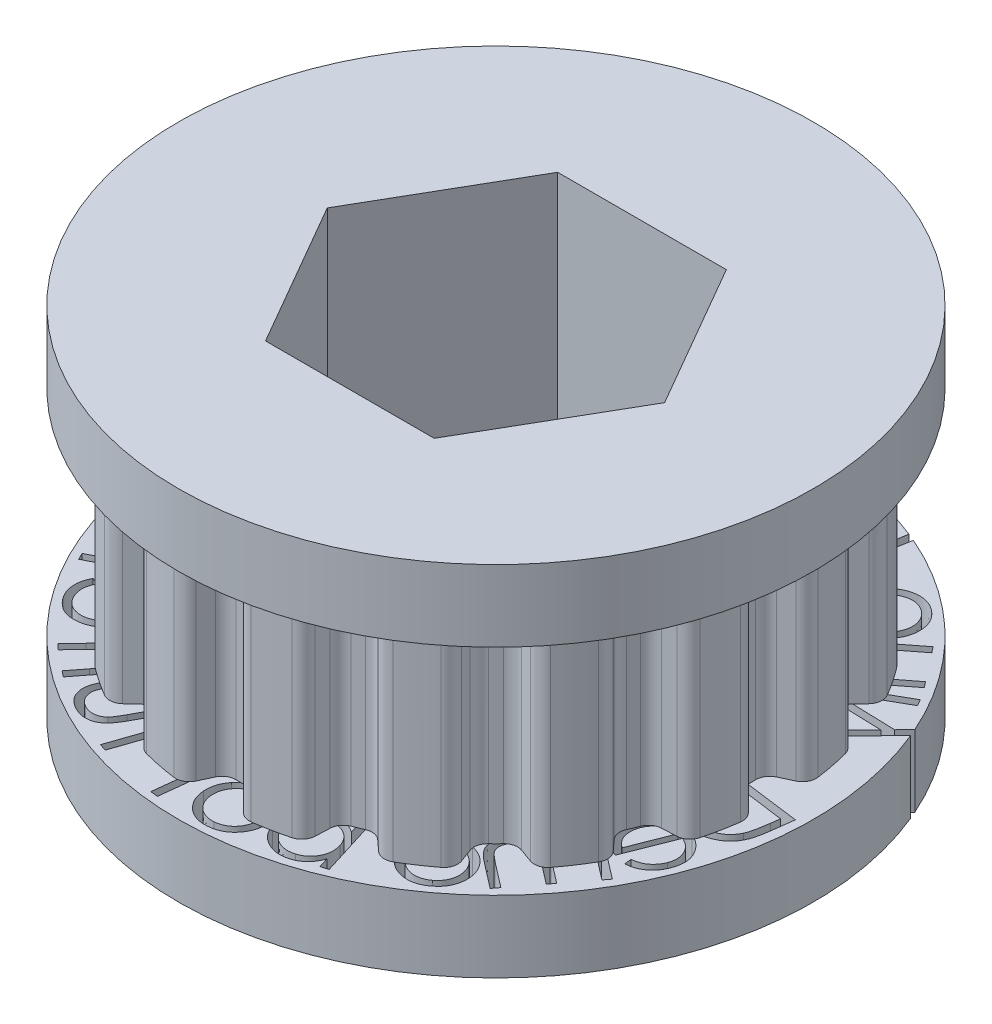
from build123d import *

# Parameters (mm, degrees)
SKETCH1_R           = 12.936113775
BOSS_EXTRUDE1_DEPTH = 9.525
CUT_EXTRUDE1_DEPTH  = 21.625511004
CIRPATTERN1_COUNT   = 16
SKETCH3_R           = 14.082113769
BOSS_EXTRUDE2_DEPTH = 3.175
BOSS_EXTRUDE3_START = 3.175
SKETCH4_R           = 14.082113769
BOSS_EXTRUDE3_DEPTH = 3.175
CUT_EXTRUDE2_DEPTH  = 26.468166039
CUT_EXTRUDE3_DEPTH  = 3.175


with BuildPart() as part:
    # Sketch1 → Boss-Extrude1 (new body)
    with BuildSketch(Plane(origin=(0, 0, 0), x_dir=(1, 0, 0), z_dir=(0, 1, 0))):
        Circle(SKETCH1_R)
    extrude(amount=BOSS_EXTRUDE1_DEPTH)

    # Sketch2 → Cut-Extrude1 (cut, through all)
    with BuildSketch(Plane(origin=(0, 9.525, 0), x_dir=(1, 0, 0), z_dir=(0, 1, 0))):
        with BuildLine():
            Line((-0.806314741, 11.631615153), (-1.080192187, 12.218947233))
            ThreePointArc((-1.080192187, 12.218947233), (-1.340918493, 12.496654586), (-1.715556917, 12.565543134))
            ThreePointArc((-1.715556917, 12.565543134), (-2.095821191, 12.507739337), (-2.47415766, 12.438430514))
            Line((-2.47415766, 12.438430514), (-2.523710602, 12.687549976))
            ThreePointArc((-2.523710602, 12.687549976), (0, 12.936113775), (2.523710602, 12.687549976))
            Line((2.523710602, 12.687549976), (2.47415766, 12.438430514))
            ThreePointArc((2.47415766, 12.438430514), (2.095821191, 12.507739337), (1.715556917, 12.565543134))
            ThreePointArc((1.715556917, 12.565543134), (1.340918493, 12.496654586), (1.080192187, 12.218947233))
            Line((1.080192187, 12.218947233), (0.806314741, 11.631615153))
            ThreePointArc((0.806314741, 11.631615153), (0.575718165, 11.37147969), (0.240465529, 11.279550864))
            ThreePointArc((0.240465529, 11.279550864), (0, 11.282113781), (-0.240465529, 11.279550864))
            ThreePointArc((-0.240465529, 11.279550864), (-0.575718165, 11.37147969), (-0.806314741, 11.631615153))
        make_face()
    cut_extrude1 = extrude(amount=-CUT_EXTRUDE1_DEPTH, mode=Mode.SUBTRACT)

    # CirPattern1: Cut-Extrude1 ×16 about axis
    cirpattern1_axis = Axis((0, 9.525, 0), (0, -1, 0))
    for i in range(1, CIRPATTERN1_COUNT):
        add(cut_extrude1.rotate(cirpattern1_axis, i * 360 / CIRPATTERN1_COUNT), mode=Mode.SUBTRACT)

    # Sketch3 → Boss-Extrude2 (add)
    with BuildSketch(Plane(origin=(0, 9.525, 0), x_dir=(1, 0, 0), z_dir=(0, 1, 0))):
        Circle(SKETCH3_R)
    extrude(amount=BOSS_EXTRUDE2_DEPTH)

    # Sketch4 → Boss-Extrude3 (add)
    with BuildSketch(Plane.XZ.offset(BOSS_EXTRUDE3_START)):
        Circle(SKETCH4_R)
    extrude(amount=-BOSS_EXTRUDE3_DEPTH)

    # Sketch5 → Cut-Extrude2 (cut, through all)
    with BuildSketch(Plane.XZ.offset(3.175)):
        Polygon((-3.739497694, -6.477), (3.739497694, -6.477), (7.478995387, 0), (3.739497694, 6.477), (-3.739497694, 6.477), (-7.478995387, 0), align=None)
    extrude(amount=-CUT_EXTRUDE2_DEPTH, mode=Mode.SUBTRACT)

    # Sketch6 → Cut-Extrude3 (cut)
    # profile 1 of 31: a face of its own
    with BuildSketch(Plane.XZ.offset(3.175)):
        with BuildLine():
            Line((13.698708504, 0.419971955), (10.249890395, -0.034354968))
            Line((10.249890395, -0.034354968), (10.155940075, 0.680088141))
            add(Edge.make_bspline(
                [(10.155940075, 0.680088141), (10.148128723, 0.742451283), (10.13305087, 0.862827671), (10.11664512, 1.037281348), (10.103909103, 1.198982387), (10.098428744, 1.347971055), (10.098042732, 1.484341725), (10.103500813, 1.607642354), (10.113889706, 1.718538608), (10.126723606, 1.787462679), (10.132803056, 1.820112179)],
                knots=[0, 0, 0, 0, 1.317480061, 2.543064479, 3.672982081, 4.717273162, 5.667741363, 6.530912118, 7.304089489, 8, 8, 8, 8], degree=3))
            add(Edge.make_bspline(
                [(10.132803056, 1.820112179), (10.14254494, 1.863093075), (10.161833642, 1.948194233), (10.203979617, 2.070765422), (10.253789673, 2.188121529), (10.312782777, 2.299434478), (10.380028474, 2.405552535), (10.458142739, 2.504320766), (10.543410501, 2.598792585), (10.638262844, 2.686166312), (10.740567811, 2.766652126), (10.849404413, 2.839797824), (10.964912302, 2.904693567), (11.087162211, 2.960322806), (11.215106951, 3.009120808), (11.349647104, 3.049023355), (11.49049653, 3.080586288), (11.587059556, 3.095104524), (11.636008184, 3.102463942)],
                knots=[0, 0, 0, 0, 0.998625791, 1.977255457, 2.93399076, 3.88690287, 4.830620759, 5.778273019, 6.738567775, 7.713517721, 8.698368508, 9.687486926, 10.683945185, 11.698776746, 12.730199312, 13.786438473, 14.877926628, 16, 16, 16, 16], degree=3))
            add(Edge.make_bspline(
                [(11.636008184, 3.102463942), (11.67849985, 3.107352703), (11.762609391, 3.117029694), (11.88787852, 3.123554292), (12.010343437, 3.121159303), (12.129503889, 3.112128588), (12.246065531, 3.096350632), (12.359301126, 3.071467126), (12.470005897, 3.040087386), (12.576886361, 3.000686571), (12.679425504, 2.955420457), (12.776595537, 2.904777559), (12.867934937, 2.849275194), (12.953882622, 2.789151983), (13.03316013, 2.723028181), (13.106395792, 2.651888334), (13.173788312, 2.575901801), (13.236537567, 2.494698653), (13.292684895, 2.405203135), (13.345126269, 2.30731656), (13.391273707, 2.199039187), (13.4347424, 2.081645458), (13.470931302, 1.953844251), (13.504197363, 1.816889093), (13.532036674, 1.670103), (13.546721093, 1.568704288), (13.554277415, 1.516526442)],
                knots=[0, 0, 0, 0, 1.085632863, 2.148940955, 3.181397112, 4.192913389, 5.181285818, 6.164570456, 7.133521653, 8.100127003, 9.05369937, 9.977156231, 10.879659723, 11.765214485, 12.637251592, 13.497340193, 14.354620953, 15.213726829, 16.099202095, 17.033439821, 18.029810369, 19.084610264, 20.209227068, 21.399247548, 22.661702338, 24, 24, 24, 24], degree=3))
            Line((13.554277415, 1.516526442), (13.698708504, 0.419971955))
        make_face()
        with BuildLine():
            Line((13.329217319, 0.707431891), (13.276633184, 1.105669071))
            add(Edge.make_bspline(
                [(13.276633184, 1.105669071), (13.268949155, 1.162965226), (13.254186447, 1.273043731), (13.228779136, 1.43077284), (13.202931979, 1.574545032), (13.17686155, 1.704253482), (13.148514952, 1.819655704), (13.120456392, 1.921210189), (13.090578154, 2.008858297), (13.067774524, 2.061421383), (13.057182062, 2.08583734)],
                knots=[0, 0, 0, 0, 1.377055125, 2.645625499, 3.805358145, 4.85680786, 5.796606887, 6.635512997, 7.366185317, 8, 8, 8, 8], degree=3))
            add(Edge.make_bspline(
                [(13.057182062, 2.08583734), (13.042067186, 2.116058496), (13.012091939, 2.175991947), (12.957999658, 2.259707423), (12.900471729, 2.339040654), (12.835092954, 2.410345607), (12.76553676, 2.477020607), (12.689674434, 2.53722981), (12.608063135, 2.591441344), (12.520889602, 2.638923723), (12.429728599, 2.680405978), (12.334055627, 2.713364599), (12.234901599, 2.739272388), (12.132091748, 2.758410417), (12.025361245, 2.768752151), (11.915277082, 2.77114039), (11.801405072, 2.767418525), (11.724772189, 2.758528769), (11.685787831, 2.75400641)],
                knots=[0, 0, 0, 0, 0.988230525, 1.959821255, 2.913354311, 3.852923489, 4.786723405, 5.731060992, 6.683415695, 7.650759435, 8.633506408, 9.611289499, 10.608404603, 11.630727226, 12.668673987, 13.742926523, 14.851791096, 16, 16, 16, 16], degree=3))
            add(Edge.make_bspline(
                [(11.685787831, 2.75400641), (11.645019895, 2.748030838), (11.564859145, 2.736281253), (11.448043698, 2.709150743), (11.336594198, 2.675939983), (11.230778451, 2.634844768), (11.130423208, 2.587536741), (11.035929135, 2.532257154), (10.946632513, 2.470642614), (10.863522679, 2.402010259), (10.786649419, 2.327800253), (10.718285982, 2.247376806), (10.655657566, 2.163304918), (10.60258605, 2.072978026), (10.55677245, 1.978026469), (10.518839098, 1.877858977), (10.488497235, 1.772793068), (10.474838232, 1.700351286), (10.467939274, 1.663762019)],
                knots=[0, 0, 0, 0, 1.12227257, 2.20669033, 3.264321196, 4.288428512, 5.296754065, 6.284089796, 7.267990161, 8.249662451, 9.217858618, 10.175166958, 11.122768282, 12.070711887, 13.024838029, 13.992259061, 14.98591993, 16, 16, 16, 16], degree=3))
            add(Edge.make_bspline(
                [(10.467939274, 1.663762019), (10.463501544, 1.633661815), (10.454040828, 1.569491719), (10.449046116, 1.465866874), (10.446701331, 1.349896553), (10.449857168, 1.221026231), (10.457942089, 1.079858051), (10.469597912, 0.925736001), (10.487627574, 0.759157359), (10.501901869, 0.643843719), (10.50930546, 0.584034455)],
                knots=[0, 0, 0, 0, 0.673475221, 1.435769954, 2.295124029, 3.242555821, 4.289654199, 5.426605339, 6.665267704, 8, 8, 8, 8], degree=3))
            Line((10.50930546, 0.584034455), (10.541557062, 0.340044071))
            Line((10.541557062, 0.340044071), (13.329217319, 0.707431891))
        make_face(mode=Mode.SUBTRACT)
    # profile 2 of 31: a face of its own
    with BuildSketch(Plane.XZ.offset(3.175)):
        with BuildLine():
            Line((11.57291789, 5.585597931), (11.607272858, 5.89759713))
            add(Edge.make_bspline(
                [(11.607272858, 5.89759713), (11.655558895, 5.892182784), (11.749522903, 5.881646537), (11.884423571, 5.851389645), (12.009843928, 5.813578244), (12.125199423, 5.764597181), (12.231655747, 5.706522641), (12.331209226, 5.640762451), (12.42275802, 5.564788756), (12.508187007, 5.480697311), (12.585655187, 5.385784458), (12.655890363, 5.280914187), (12.718830029, 5.165184234), (12.753399897, 5.082529143), (12.771135037, 5.040125175)],
                knots=[0, 0, 0, 0, 1.141725117, 2.22178241, 3.245586201, 4.218279401, 5.16253732, 6.093785027, 7.019046661, 7.955533042, 8.908244248, 9.894365599, 10.919760979, 12, 12, 12, 12], degree=3))
            add(Edge.make_bspline(
                [(12.771135037, 5.040125175), (12.788621561, 4.992504448), (12.822802973, 4.899418837), (12.85797814, 4.757784758), (12.877747196, 4.619400416), (12.883180873, 4.48421742), (12.872647664, 4.352156349), (12.846435013, 4.223267562), (12.805536925, 4.097629377), (12.749991506, 3.977028133), (12.683256221, 3.863097489), (12.610188452, 3.755850097), (12.528001448, 3.65883696), (12.439678782, 3.570040405), (12.343871895, 3.4904904), (12.240901519, 3.420016102), (12.130640291, 3.358499675), (12.052589209, 3.325632678), (12.013222377, 3.309055463)],
                knots=[0, 0, 0, 0, 1.151464618, 2.25080115, 3.306903861, 4.32133317, 5.317039498, 6.307981383, 7.301620253, 8.311038629, 9.316976508, 10.29750165, 11.254340131, 12.200103513, 13.138585992, 14.077833594, 15.030511823, 16, 16, 16, 16], degree=3))
            add(Edge.make_bspline(
                [(12.013222377, 3.309055463), (11.975590504, 3.295018392), (11.901286393, 3.267302202), (11.786722737, 3.238512497), (11.672265542, 3.217429753), (11.556985876, 3.207934842), (11.441604066, 3.207866682), (11.325927148, 3.217674444), (11.210103467, 3.238047729), (11.133875994, 3.258687936), (11.095453947, 3.269091521)],
                knots=[0, 0, 0, 0, 1.028636313, 2.031041778, 3.022688303, 4.0085657, 4.990870406, 5.976747803, 6.98019064, 8, 8, 8, 8], degree=3))
            add(Edge.make_bspline(
                [(11.095453947, 3.269091521), (11.047575139, 3.284807748), (10.953764824, 3.315601), (10.822428478, 3.380073805), (10.701186385, 3.455602909), (10.592180584, 3.546245058), (10.49399495, 3.649272461), (10.407339545, 3.765350056), (10.331444306, 3.894339646), (10.291863099, 3.987704977), (10.271635838, 4.035417642)],
                knots=[0, 0, 0, 0, 1.034651541, 2.027222296, 2.99875199, 3.9643735, 4.932715346, 5.917455714, 6.935753384, 8, 8, 8, 8], degree=3))
            add(Edge.make_bspline(
                [(10.271635838, 4.035417642), (10.253450967, 4.085553866), (10.217851739, 4.183701982), (10.184446203, 4.33413997), (10.167675532, 4.482287831), (10.169430974, 4.628641418), (10.187035472, 4.773178615), (10.224879389, 4.915127346), (10.277426456, 5.056038645), (10.326551936, 5.144914774), (10.351563723, 5.190165239)],
                knots=[0, 0, 0, 0, 1.064908306, 2.084695212, 3.071387578, 4.038248051, 5.003392268, 5.973091419, 6.968018106, 8, 8, 8, 8], degree=3))
            add(Edge.make_bspline(
                [(10.351563723, 5.190165239), (10.371089158, 5.221869186), (10.410017185, 5.285077617), (10.478934609, 5.373309556), (10.556094626, 5.455248497), (10.641493947, 5.53117601), (10.734478793, 5.601637504), (10.83572195, 5.666145188), (10.945348923, 5.724760227), (11.022957194, 5.75751171), (11.062501223, 5.774199694)],
                knots=[0, 0, 0, 0, 0.952728858, 1.899463636, 2.860368647, 3.830839196, 4.82173641, 5.844215965, 6.901555401, 8, 8, 8, 8], degree=3))
            Line((11.062501223, 5.774199694), (11.906651864, 3.631571489))
            add(Edge.make_bspline(
                [(11.906651864, 3.631571489), (11.940120303, 3.646422502), (12.005560494, 3.675460401), (12.097410383, 3.728051396), (12.181668497, 3.786161627), (12.258442051, 3.849964997), (12.327167001, 3.919883888), (12.387372706, 3.996190155), (12.441402627, 4.077557189), (12.485422301, 4.1650156), (12.522115755, 4.254910043), (12.548825161, 4.346316593), (12.565984034, 4.438382989), (12.572939477, 4.530767893), (12.570082876, 4.623834389), (12.557292611, 4.717070885), (12.534949887, 4.811123381), (12.512582722, 4.872288105), (12.501203146, 4.903406425)],
                knots=[0, 0, 0, 0, 1.122152068, 2.194122256, 3.239730774, 4.257286696, 5.250528897, 6.239885666, 7.233696453, 8.240062434, 9.236788574, 10.207384585, 11.154739034, 12.103393605, 13.042608862, 14.004408271, 14.984717722, 16, 16, 16, 16], degree=3))
            add(Edge.make_bspline(
                [(12.501203146, 4.903406425), (12.488703116, 4.933365995), (12.463825639, 4.992991331), (12.416035068, 5.077463514), (12.361225657, 5.157569409), (12.299788984, 5.232628072), (12.234049779, 5.302039291), (12.163299597, 5.362066627), (12.091313406, 5.415448611), (12.01349215, 5.460332277), (11.926008158, 5.499245207), (11.823360326, 5.53211294), (11.704201215, 5.56229398), (11.618377959, 5.577528367), (11.57291789, 5.585597931)],
                knots=[0, 0, 0, 0, 0.961679637, 1.913928356, 2.870979394, 3.836221604, 4.78688099, 5.700721936, 6.583514537, 7.440339789, 8.358399795, 9.416663679, 10.63162209, 12, 12, 12, 12], degree=3))
        make_face()
        with BuildLine():
            add(Edge.make_bspline(
                [(10.930690326, 5.332492963), (10.895849946, 5.306458115), (10.828806117, 5.256358893), (10.739675681, 5.17416846), (10.666404414, 5.088988624), (10.606400224, 5.00144328), (10.561166125, 4.908633441), (10.527336412, 4.810152804), (10.504441697, 4.705205091), (10.491917497, 4.595289974), (10.490872354, 4.483080674), (10.503566587, 4.371614299), (10.525683643, 4.261391627), (10.551181963, 4.190803998), (10.564003627, 4.155309469)],
                knots=[0, 0, 0, 0, 1.16865488, 2.248858906, 3.251211367, 4.183404252, 5.093705487, 6.017541543, 6.976283192, 7.975302982, 8.98676855, 9.985096751, 10.986819025, 12, 12, 12, 12], degree=3))
            add(Edge.make_bspline(
                [(10.564003627, 4.155309469), (10.575822141, 4.126761146), (10.59909389, 4.070546856), (10.643372313, 3.991889631), (10.692338926, 3.918320098), (10.74788443, 3.851256212), (10.808580558, 3.789404496), (10.875599094, 3.734233063), (10.947833079, 3.683583408), (11.000239144, 3.656025826), (11.026744012, 3.642088316)],
                knots=[0, 0, 0, 0, 1.047562245, 2.062747029, 3.056899811, 4.042826732, 5.012935618, 5.992752124, 6.984815216, 8, 8, 8, 8], degree=3))
            add(Edge.make_bspline(
                [(11.026744012, 3.642088316), (11.046937185, 3.632648409), (11.0880309, 3.613437915), (11.153393448, 3.590286487), (11.223182603, 3.572933868), (11.29683408, 3.560629278), (11.37429713, 3.552066338), (11.455809015, 3.548527087), (11.541247282, 3.5509712), (11.599343999, 3.555593565), (11.629007633, 3.5579537)],
                knots=[0, 0, 0, 0, 0.867946128, 1.766296421, 2.695839858, 3.665656488, 4.67298816, 5.729980605, 6.84094956, 8, 8, 8, 8], degree=3))
            Line((11.629007633, 3.5579537), (10.930690326, 5.332492963))
        make_face(mode=Mode.SUBTRACT)
    # profile 3 of 31: a face of its own
    with BuildSketch(Plane.XZ.offset(3.175)):
        with BuildLine():
            Line((9.86702436, 5.181953452), (9.666503527, 5.443471882))
            Line((9.666503527, 5.443471882), (10.020570033, 5.714806016))
            add(Edge.make_bspline(
                [(10.020570033, 5.714806016), (9.972401082, 5.713670984), (9.880132936, 5.711496817), (9.747669972, 5.722652557), (9.627013462, 5.741768429), (9.553151871, 5.766223817), (9.517865706, 5.777906978)],
                knots=[0, 0, 0, 0, 1.133407867, 2.171055053, 3.126251534, 4, 4, 4, 4], degree=3))
            add(Edge.make_bspline(
                [(9.517865706, 5.777906978), (9.473785409, 5.797061853), (9.386947251, 5.834796945), (9.268633343, 5.911142057), (9.162151236, 6.000161162), (9.103443612, 6.070714313), (9.07405561, 6.106031978)],
                knots=[0, 0, 0, 0, 1.031166216, 2.031396835, 3.014551928, 4, 4, 4, 4], degree=3))
            add(Edge.make_bspline(
                [(9.07405561, 6.106031978), (9.055922633, 6.131121437), (9.020004951, 6.180818475), (8.976981743, 6.26182994), (8.94055223, 6.345233088), (8.914263101, 6.432133517), (8.896758862, 6.519481287), (8.888687444, 6.605773058), (8.890958055, 6.689493332), (8.902025025, 6.772265965), (8.925494253, 6.856264967), (8.961276143, 6.943760487), (9.008436902, 7.037149449), (9.047760408, 7.098695559), (9.068446636, 7.131072042)],
                knots=[0, 0, 0, 0, 1.007695899, 1.996037493, 2.982087516, 3.969842034, 4.948185078, 5.881125755, 6.787736693, 7.672031518, 8.59585, 9.621206849, 10.74863, 12, 12, 12, 12], degree=3))
            add(Edge.make_bspline(
                [(9.068446636, 7.131072042), (9.040212551, 7.12692247), (8.984850138, 7.118785838), (8.902121346, 7.113745212), (8.821626185, 7.111940638), (8.742931691, 7.115481019), (8.666335937, 7.123837092), (8.591836132, 7.137160991), (8.519419254, 7.155382716), (8.426748493, 7.186072256), (8.31681316, 7.234918452), (8.196237468, 7.310378536), (8.087659027, 7.401338851), (8.027434218, 7.473413808), (7.997132533, 7.509677811)],
                knots=[0, 0, 0, 0, 0.859422187, 1.685186051, 2.495066026, 3.284484918, 4.056631396, 4.814912059, 5.562922972, 6.304409636, 7.754316416, 9.174684802, 10.578462708, 12, 12, 12, 12], degree=3))
            add(Edge.make_bspline(
                [(7.997132533, 7.509677811), (7.97191474, 7.544971324), (7.922405323, 7.61426213), (7.868806483, 7.728611805), (7.831326675, 7.846145571), (7.813075048, 7.967082053), (7.813941276, 8.088830079), (7.832830425, 8.209561714), (7.871694728, 8.327423948), (7.918189263, 8.423467627), (7.967690657, 8.499091461), (8.012315941, 8.55931253), (8.065704676, 8.62095791), (8.125612357, 8.685729721), (8.195078558, 8.751219022), (8.27105586, 8.820030132), (8.3558113, 8.890261927), (8.415577229, 8.936853376), (8.446551604, 8.960999927)],
                knots=[0, 0, 0, 0, 1.201644218, 2.359155803, 3.487405147, 4.615654492, 5.737734918, 6.854158818, 7.992523032, 9.17019277, 9.803457681, 10.498751609, 11.248680507, 12.065492715, 12.94623954, 13.896928186, 14.910059039, 16, 16, 16, 16], degree=3))
            Line((8.446551604, 8.960999927), (9.565541988, 9.819874125))
            Line((9.565541988, 9.819874125), (9.771671796, 9.550643356))
            Line((9.771671796, 9.550643356), (8.652681411, 8.691769157))
            add(Edge.make_bspline(
                [(8.652681411, 8.691769157), (8.626456259, 8.671268489), (8.576018944, 8.631840742), (8.504448763, 8.574227592), (8.441561737, 8.518956505), (8.384587171, 8.468933069), (8.336731091, 8.420598237), (8.295729093, 8.376240852), (8.261623496, 8.336130797), (8.22803677, 8.286477194), (8.196702902, 8.224600142), (8.170871937, 8.147405124), (8.158232016, 8.066142265), (8.158574119, 7.982262375), (8.170804025, 7.89693182), (8.198247973, 7.812973602), (8.238441909, 7.730256822), (8.274906305, 7.679551192), (8.293707052, 7.653407779)],
                knots=[0, 0, 0, 0, 1.263127909, 2.429300645, 3.485454222, 4.439912584, 5.305262591, 6.064659029, 6.732299467, 7.30047731, 8.335609868, 9.353582227, 10.377063323, 11.441228294, 12.526069252, 13.633864759, 14.780039815, 16, 16, 16, 16], degree=3))
            add(Edge.make_bspline(
                [(8.293707052, 7.653407779), (8.319133142, 7.622760982), (8.369437427, 7.562127781), (8.461938425, 7.48840584), (8.563904177, 7.428337881), (8.676168371, 7.38570111), (8.793835453, 7.358024293), (8.914651267, 7.349040365), (9.03654637, 7.357501897), (9.139028062, 7.380230698), (9.224412997, 7.408545874), (9.294345813, 7.440405394), (9.371015297, 7.478896137), (9.453655273, 7.526249088), (9.542590194, 7.581569374), (9.637261094, 7.64579807), (9.73828777, 7.717994359), (9.806862086, 7.770080183), (9.842485097, 7.797137747)],
                knots=[0, 0, 0, 0, 1.081894572, 2.140475914, 3.201465079, 4.293532505, 5.397368119, 6.482458952, 7.579780468, 8.713270324, 9.331132669, 10.026445836, 10.803464779, 11.667066154, 12.618950185, 13.655101411, 14.781871178, 16, 16, 16, 16], degree=3))
            Line((9.842485097, 7.797137747), (10.645269552, 8.412722683))
            Line((10.645269552, 8.412722683), (10.845790386, 8.150503132))
            Line((10.845790386, 8.150503132), (9.796211059, 7.344914189))
            add(Edge.make_bspline(
                [(9.796211059, 7.344914189), (9.766686704, 7.322109898), (9.710066951, 7.278377413), (9.629876058, 7.213921399), (9.558690763, 7.153221021), (9.495950429, 7.096725095), (9.441113207, 7.04540957), (9.395359856, 6.997560043), (9.35784478, 6.954241078), (9.319708648, 6.902556897), (9.2841259, 6.838222577), (9.254608302, 6.757834982), (9.239571053, 6.673667713), (9.236442216, 6.587154177), (9.247743026, 6.499957882), (9.273579168, 6.414213072), (9.312884983, 6.330431164), (9.349222564, 6.279395392), (9.367825642, 6.253267555)],
                knots=[0, 0, 0, 0, 1.33080092, 2.552117463, 3.669813388, 4.667513574, 5.563893863, 6.348154609, 7.028175324, 7.606806333, 8.636830843, 9.639014472, 10.64793758, 11.673939136, 12.716306136, 13.768792959, 14.857730309, 16, 16, 16, 16], degree=3))
            add(Edge.make_bspline(
                [(9.367825642, 6.253267555), (9.392120997, 6.224057694), (9.440489489, 6.165905143), (9.530204684, 6.095043796), (9.630213439, 6.036801921), (9.7403356, 5.993075119), (9.856993487, 5.965332294), (9.976933107, 5.953447091), (10.098345858, 5.961069135), (10.200459832, 5.981680438), (10.28420477, 6.008308055), (10.351921494, 6.036272031), (10.424118102, 6.070881595), (10.50122048, 6.111921465), (10.58150406, 6.161666514), (10.666890376, 6.217115312), (10.75633517, 6.280193104), (10.816707296, 6.325774988), (10.847893751, 6.349321241)],
                knots=[0, 0, 0, 0, 1.087052832, 2.164162867, 3.257396869, 4.397458244, 5.548421665, 6.686195343, 7.840957944, 9.023967919, 9.66411023, 10.358611389, 11.123098464, 11.959720237, 12.862060853, 13.830600815, 14.879352531, 16, 16, 16, 16], degree=3))
            Line((10.847893751, 6.349321241), (11.716583655, 7.016088068))
            Line((11.716583655, 7.016088068), (11.917104488, 6.754569638))
            Line((11.917104488, 6.754569638), (9.86702436, 5.181953452))
        make_face()
    # profile 4 of 31: a face of its own
    with BuildSketch(Plane.XZ.offset(3.175)):
        with BuildLine():
            add(Edge.make_bspline(
                [(6.543723496, 8.863180681), (6.505424781, 8.893018993), (6.429940979, 8.951827994), (6.32997344, 9.052110912), (6.24176934, 9.158392228), (6.168196336, 9.272544019), (6.106966143, 9.393394099), (6.060584519, 9.521633007), (6.025014316, 9.656500436), (6.013316614, 9.749672794), (6.007365322, 9.797074912)],
                knots=[0, 0, 0, 0, 1.048108323, 2.065740374, 3.052381332, 4.027218572, 4.993754926, 5.973080799, 6.968790044, 8, 8, 8, 8], degree=3))
            add(Edge.make_bspline(
                [(6.007365322, 9.797074912), (6.004242593, 9.840520088), (5.998067039, 9.926437892), (6.002591873, 10.05464278), (6.01849287, 10.179823306), (6.046949638, 10.301802797), (6.086351583, 10.420803793), (6.137178197, 10.536995649), (6.199335868, 10.650515888), (6.249698624, 10.721617753), (6.275193848, 10.757611771)],
                knots=[0, 0, 0, 0, 1.023425684, 2.023941293, 3.010066804, 3.985666611, 4.963862171, 5.952983172, 6.963735193, 8, 8, 8, 8], degree=3))
            add(Edge.make_bspline(
                [(6.275193848, 10.757611771), (6.302574679, 10.792766879), (6.356478566, 10.861975772), (6.448183561, 10.955166314), (6.546327791, 11.037985008), (6.651389985, 11.110750485), (6.763427473, 11.172774247), (6.882489878, 11.223670525), (7.007961276, 11.265756054), (7.139337817, 11.295051064), (7.272986223, 11.313799847), (7.406259193, 11.31806577), (7.537417265, 11.308228162), (7.666589951, 11.284394979), (7.793248694, 11.245489798), (7.917453563, 11.192048375), (8.040134751, 11.125642863), (8.117548478, 11.071344355), (8.157004746, 11.043669463)],
                knots=[0, 0, 0, 0, 1.007507866, 1.983452999, 2.951617427, 3.9094163, 4.870348218, 5.843783292, 6.835360458, 7.86028479, 8.884799835, 9.884688726, 10.870992973, 11.855211394, 12.850447528, 13.862068168, 14.910337805, 16, 16, 16, 16], degree=3))
            add(Edge.make_bspline(
                [(8.157004746, 11.043669463), (8.195258707, 11.014026909), (8.270246317, 10.955919872), (8.370150223, 10.857679117), (8.456842818, 10.753465481), (8.531122176, 10.643443457), (8.59265193, 10.52723941), (8.640330265, 10.404307591), (8.675616124, 10.27559472), (8.696876508, 10.142256426), (8.705516006, 10.008028496), (8.704110887, 9.875657739), (8.689193053, 9.746983675), (8.662356479, 9.621863017), (8.623699751, 9.500194987), (8.57299824, 9.382100787), (8.510314107, 9.267466363), (8.460112713, 9.19553828), (8.434648976, 9.159054079)],
                knots=[0, 0, 0, 0, 1.093149919, 2.142855232, 3.159445088, 4.152820929, 5.138200385, 6.125079681, 7.127237719, 8.149425873, 9.171286368, 10.164549832, 11.137617974, 12.093951593, 13.052922414, 14.018476404, 14.994908478, 16, 16, 16, 16], degree=3))
            add(Edge.make_bspline(
                [(8.434648976, 9.159054079), (8.407672751, 9.12442549), (8.354373919, 9.056007343), (8.264847911, 8.963310739), (8.168984417, 8.880843117), (8.067092876, 8.808182099), (7.958247761, 8.746146466), (7.843200623, 8.69439136), (7.721869824, 8.652410153), (7.637915698, 8.633149505), (7.595406188, 8.623397027)],
                knots=[0, 0, 0, 0, 1.033007709, 2.040986261, 3.02820268, 4.006932155, 4.982966212, 5.97304642, 6.973668026, 8, 8, 8, 8], degree=3))
            add(Edge.make_bspline(
                [(7.595406188, 8.623397027), (7.548328669, 8.615047395), (7.45582287, 8.598640639), (7.316297776, 8.593282926), (7.179966053, 8.600341048), (7.046227664, 8.623297385), (6.915196421, 8.660145515), (6.787772377, 8.714084769), (6.662071442, 8.780006598), (6.583589154, 8.835163384), (6.543723496, 8.863180681)],
                knots=[0, 0, 0, 0, 1.030224309, 2.024357381, 3.003902151, 3.970230401, 4.945198442, 5.932868709, 6.949985368, 8, 8, 8, 8], degree=3))
        make_face()
        with BuildLine():
            add(Edge.make_bspline(
                [(6.736531989, 9.123997989), (6.764238121, 9.104773423), (6.819020503, 9.066761349), (6.906242183, 9.019525701), (6.996941371, 8.982999926), (7.089831965, 8.955427647), (7.185805079, 8.938471254), (7.284226567, 8.931873692), (7.38568445, 8.933609483), (7.488401396, 8.946675888), (7.590165127, 8.967814711), (7.687957473, 8.998971835), (7.78083456, 9.038110081), (7.868651912, 9.086339574), (7.951355929, 9.143132316), (8.029040119, 9.208714477), (8.100897087, 9.283631854), (8.144137111, 9.338627586), (8.166119329, 9.36658613)],
                knots=[0, 0, 0, 0, 1.0038179, 1.984814614, 2.946434601, 3.911122766, 4.865486094, 5.842400202, 6.84489006, 7.882593992, 8.921441065, 9.936226568, 10.934236409, 11.918560843, 12.91474872, 13.917335223, 14.94122191, 16, 16, 16, 16], degree=3))
            add(Edge.make_bspline(
                [(8.166119329, 9.36658613), (8.192185503, 9.40451623), (8.243861606, 9.479712528), (8.302337111, 9.603044775), (8.346137331, 9.731852045), (8.371228591, 9.865676119), (8.381038543, 10.000615504), (8.371779358, 10.133203568), (8.345061747, 10.261935734), (8.299723217, 10.384942563), (8.239469738, 10.501756541), (8.164226471, 10.60943299), (8.074147396, 10.706979034), (8.004920999, 10.762434277), (7.969805226, 10.790564495)],
                knots=[0, 0, 0, 0, 1.033113715, 2.048144488, 3.056532934, 4.083739458, 5.099938698, 6.089932011, 7.061522776, 8.045350024, 9.027492732, 10.008313862, 10.989697583, 12, 12, 12, 12], degree=3))
            add(Edge.make_bspline(
                [(7.969805226, 10.790564495), (7.932539945, 10.81608141), (7.859014849, 10.866426759), (7.739449994, 10.924261932), (7.614539867, 10.964460316), (7.48566353, 10.988374735), (7.354703844, 10.994979946), (7.223878685, 10.982427817), (7.094107412, 10.953294629), (6.968054138, 10.904267654), (6.847579223, 10.841122099), (6.736765352, 10.762447097), (6.635726198, 10.670304253), (6.57879752, 10.598818822), (6.550033592, 10.562699912)],
                knots=[0, 0, 0, 0, 1.013919894, 2.00048292, 2.972114234, 3.954853331, 4.938125587, 5.908620655, 6.899855892, 7.917211454, 8.939206416, 9.949050905, 10.963732265, 12, 12, 12, 12], degree=3))
            add(Edge.make_bspline(
                [(6.550033592, 10.562699912), (6.529605022, 10.533614736), (6.489385247, 10.476351832), (6.439437253, 10.385154828), (6.399454273, 10.291886104), (6.368783363, 10.19617484), (6.348381816, 10.098190852), (6.338907495, 9.997589391), (6.338099726, 9.895046678), (6.34709529, 9.791245818), (6.366206127, 9.689340471), (6.392373053, 9.591172882), (6.428215872, 9.499044556), (6.473192686, 9.412710138), (6.525262839, 9.330907732), (6.587851071, 9.256084262), (6.657287456, 9.185449302), (6.709852053, 9.144687329), (6.736531989, 9.123997989)],
                knots=[0, 0, 0, 0, 1.057652574, 2.082306742, 3.089227371, 4.075154009, 5.070052357, 6.062977545, 7.078970469, 8.11975453, 9.159793911, 10.162546077, 11.140780831, 12.096252633, 13.057484602, 14.021533522, 14.995800165, 16, 16, 16, 16], degree=3))
        make_face(mode=Mode.SUBTRACT)
    # profile 5 of 31: a face of its own
    with BuildSketch(Plane.XZ.offset(3.175)):
        with BuildLine():
            Line((5.266781504, 12.660644098), (4.205984228, 9.257398905))
            Line((4.205984228, 9.257398905), (3.891881664, 9.355555957))
            Line((3.891881664, 9.355555957), (4.318864837, 10.725547944))
            add(Edge.make_bspline(
                [(4.318864837, 10.725547944), (4.273628337, 10.696966086), (4.185137793, 10.641054949), (4.045243735, 10.575725641), (3.904375336, 10.527705412), (3.762381768, 10.496147675), (3.618943886, 10.482944508), (3.474535967, 10.486654435), (3.328520288, 10.506699138), (3.233043025, 10.533249203), (3.184449773, 10.546761886)],
                knots=[0, 0, 0, 0, 1.078428809, 2.109596286, 3.105365901, 4.075283104, 5.036374378, 6.002998485, 6.983624015, 8, 8, 8, 8], degree=3))
            add(Edge.make_bspline(
                [(3.184449773, 10.546761886), (3.142027435, 10.561055197), (3.05855793, 10.589178484), (2.94072399, 10.646425952), (2.830734928, 10.712881914), (2.729522725, 10.790582058), (2.636189475, 10.877705353), (2.552500473, 10.976272889), (2.476737258, 11.084495388), (2.409769873, 11.201470132), (2.354344338, 11.324646281), (2.310300739, 11.450502803), (2.279990411, 11.578073346), (2.262978155, 11.707058281), (2.259738891, 11.837437396), (2.26885867, 11.969155115), (2.291230139, 12.10233041), (2.315875442, 12.189920355), (2.328380062, 12.234362046)],
                knots=[0, 0, 0, 0, 1.019992657, 2.006921038, 2.980402664, 3.946194104, 4.911455973, 5.886701404, 6.889207778, 7.920486717, 8.955738235, 9.965373947, 10.956911182, 11.940610625, 12.926977585, 13.926049493, 14.947711761, 16, 16, 16, 16], degree=3))
            add(Edge.make_bspline(
                [(2.328380062, 12.234362046), (2.342960637, 12.277687437), (2.371721952, 12.36315013), (2.428936499, 12.484187337), (2.497025075, 12.596031155), (2.573127758, 12.700730906), (2.661199549, 12.79579099), (2.758620072, 12.882996074), (2.866737189, 12.960990416), (2.98318435, 13.02983493), (3.104962708, 13.088458364), (3.229878199, 13.133334546), (3.355331513, 13.166228231), (3.482251975, 13.185193255), (3.61032909, 13.190851707), (3.739267099, 13.182873127), (3.869300436, 13.162123141), (3.954490629, 13.137826118), (3.997751055, 13.125487848)],
                knots=[0, 0, 0, 0, 1.042118395, 2.055659326, 3.045824943, 4.025719035, 5.002941132, 5.995972895, 7.003678527, 8.038654448, 9.078315464, 10.081710867, 11.061822463, 12.032156668, 13.003354531, 13.980707493, 14.974583191, 16, 16, 16, 16], degree=3))
            add(Edge.make_bspline(
                [(3.997751055, 13.125487848), (4.046145624, 13.108915463), (4.141563245, 13.07624036), (4.274186391, 13.007472202), (4.394964359, 12.925316731), (4.503701499, 12.829332634), (4.600225584, 12.719260699), (4.684225985, 12.595056609), (4.756197427, 12.457135891), (4.792957272, 12.357979661), (4.811753459, 12.307278713)],
                knots=[0, 0, 0, 0, 1.020628605, 2.012332255, 2.973074117, 3.932181446, 4.901380696, 5.889297523, 6.92074741, 8, 8, 8, 8], degree=3))
            Line((4.811753459, 12.307278713), (4.95267894, 12.758801149))
            Line((4.95267894, 12.758801149), (5.266781504, 12.660644098))
        make_face()
        with BuildLine():
            add(Edge.make_bspline(
                [(3.927638876, 12.813488649), (3.883961278, 12.825511429), (3.797618221, 12.849278385), (3.664065218, 12.862504237), (3.53095522, 12.859169652), (3.398839871, 12.838137433), (3.270712095, 12.799402735), (3.148033642, 12.744715846), (3.033908567, 12.671399037), (2.928653904, 12.583303243), (2.834401124, 12.483188909), (2.754564647, 12.372598874), (2.688727774, 12.254018818), (2.658841636, 12.168958455), (2.643884869, 12.12638929)],
                knots=[0, 0, 0, 0, 1.006850734, 1.990369794, 2.973916368, 3.964290448, 4.958346584, 5.94555956, 6.944219499, 7.967294787, 8.994119358, 9.996187887, 10.99717558, 12, 12, 12, 12], degree=3))
            add(Edge.make_bspline(
                [(2.643884869, 12.12638929), (2.63222141, 12.082690593), (2.608904483, 11.995330634), (2.594530085, 11.859810239), (2.598622243, 11.722556467), (2.618409017, 11.585093719), (2.656312484, 11.451737978), (2.708640537, 11.325325221), (2.778514688, 11.209613555), (2.861598469, 11.103813514), (2.957455761, 11.010425405), (3.064000594, 10.932624621), (3.178876308, 10.868291128), (3.261302406, 10.839134419), (3.302939356, 10.824406117)],
                knots=[0, 0, 0, 0, 1.005334625, 2.009807988, 3.019062793, 4.054625729, 5.09188492, 6.096412134, 7.089988687, 8.089833583, 9.082838325, 10.057478977, 11.018749477, 12, 12, 12, 12], degree=3))
            add(Edge.make_bspline(
                [(3.302939356, 10.824406117), (3.34616177, 10.812640014), (3.432310516, 10.789188406), (3.566262593, 10.776314317), (3.701744379, 10.778468241), (3.837023661, 10.800255075), (3.968838722, 10.836352785), (4.092478084, 10.890029388), (4.205950579, 10.95948826), (4.308556832, 11.044186307), (4.400232666, 11.142299155), (4.477202541, 11.254293487), (4.542349121, 11.377166795), (4.573115457, 11.465686706), (4.588796728, 11.510804354)],
                knots=[0, 0, 0, 0, 0.990886931, 1.974986141, 2.969370895, 3.985835633, 5.002221238, 5.990127317, 6.961654613, 7.940221256, 8.929469831, 9.926332067, 10.943073727, 12, 12, 12, 12], degree=3))
            add(Edge.make_bspline(
                [(4.588796728, 11.510804354), (4.598760104, 11.54594255), (4.618307875, 11.614882375), (4.636738532, 11.719574234), (4.644287891, 11.822662263), (4.642611817, 11.92416659), (4.629568312, 12.023712349), (4.607273756, 12.121787184), (4.57380786, 12.218127689), (4.531426784, 12.312049332), (4.480618883, 12.401348289), (4.422270326, 12.483915393), (4.356715206, 12.558391726), (4.284795759, 12.62587937), (4.205196814, 12.684616227), (4.119219703, 12.735905693), (4.026683136, 12.780234039), (3.96109337, 12.802256134), (3.927638876, 12.813488649)],
                knots=[0, 0, 0, 0, 1.074672365, 2.108466914, 3.122616767, 4.113514851, 5.091431176, 6.072729633, 7.069176875, 8.088354678, 9.102107754, 10.089009348, 11.059150811, 12.018104188, 12.986780918, 13.964890823, 14.961979104, 16, 16, 16, 16], degree=3))
        make_face(mode=Mode.SUBTRACT)
    # profile 6 of 31: a face of its own
    with BuildSketch(Plane.XZ.offset(3.175)):
        with BuildLine():
            add(Edge.make_bspline(
                [(0.718848878, 10.99097768), (0.670339465, 10.995386224), (0.57519127, 11.004033307), (0.436775814, 11.033312811), (0.305696367, 11.075163812), (0.181918609, 11.131246276), (0.065234803, 11.20002698), (-0.044154408, 11.282218416), (-0.146568342, 11.376861778), (-0.206913037, 11.448818263), (-0.23748125, 11.485268546)],
                knots=[0, 0, 0, 0, 1.052001883, 2.063436225, 3.050603381, 4.020431483, 4.994119012, 5.972003011, 6.972697679, 8, 8, 8, 8], degree=3))
            add(Edge.make_bspline(
                [(-0.23748125, 11.485268546), (-0.263612386, 11.520105941), (-0.315227339, 11.588917741), (-0.380570096, 11.699160332), (-0.434699491, 11.813006219), (-0.478028869, 11.930686788), (-0.508675279, 12.052493062), (-0.528247495, 12.177796443), (-0.537132925, 12.306896136), (-0.533696619, 12.393920743), (-0.531952404, 12.438093065)],
                knots=[0, 0, 0, 0, 1.023148417, 2.020951437, 3.006396344, 3.983180976, 4.963897587, 5.953850045, 6.961406462, 8, 8, 8, 8], degree=3))
            add(Edge.make_bspline(
                [(-0.531952404, 12.438093065), (-0.527880029, 12.482378005), (-0.519830367, 12.569913862), (-0.493353555, 12.69782119), (-0.45622606, 12.820984965), (-0.406783556, 12.938594677), (-0.347146033, 13.052074208), (-0.274368941, 13.159035369), (-0.190921308, 13.261609292), (-0.097220343, 13.357936241), (0.004814264, 13.446307889), (0.114939999, 13.521459225), (0.230297786, 13.584510476), (0.352001477, 13.633756498), (0.479329487, 13.670430376), (0.612605261, 13.6933756), (0.75168542, 13.703459374), (0.845982667, 13.699851204), (0.894129327, 13.69800893)],
                knots=[0, 0, 0, 0, 1.005855321, 1.988224619, 2.950334923, 3.91301212, 4.871334574, 5.846916364, 6.835757838, 7.860680591, 8.884770424, 9.885368831, 10.872341146, 11.854582274, 12.850696813, 13.865524261, 14.910170964, 16, 16, 16, 16], degree=3))
            add(Edge.make_bspline(
                [(0.894129327, 13.69800893), (0.94241039, 13.693874923), (1.036853955, 13.685788308), (1.173862536, 13.656794432), (1.30372874, 13.617158501), (1.425985213, 13.564467802), (1.540463422, 13.499533076), (1.646929575, 13.422363531), (1.746501549, 13.3337159), (1.836520152, 13.23307656), (1.917213838, 13.125226613), (1.987079327, 13.013029879), (2.044196363, 12.896880456), (2.090329668, 12.777641076), (2.122928781, 12.654082429), (2.145082713, 12.527479418), (2.154399628, 12.39705568), (2.15090566, 12.309319717), (2.14913734, 12.264915982)],
                knots=[0, 0, 0, 0, 1.094336351, 2.140653473, 3.15815996, 4.159022056, 5.143114196, 6.126837673, 7.125690507, 8.150451767, 9.173100663, 10.166968723, 11.133163015, 12.094551492, 13.0517078, 14.016514919, 14.996145451, 16, 16, 16, 16], degree=3))
            add(Edge.make_bspline(
                [(2.14913734, 12.264915982), (2.145228541, 12.221115886), (2.13750853, 12.134609209), (2.112777685, 12.008000962), (2.076710513, 11.886780008), (2.030436875, 11.770387042), (1.972682797, 11.659420828), (1.904142299, 11.553572314), (1.82482616, 11.452793432), (1.764569353, 11.391027587), (1.734073237, 11.359767745)],
                knots=[0, 0, 0, 0, 1.034602818, 2.043375734, 3.030311808, 4.007943351, 4.987229656, 5.969924922, 6.972574111, 8, 8, 8, 8], degree=3))
            add(Edge.make_bspline(
                [(1.734073237, 11.359767745), (1.699024686, 11.327129252), (1.630101014, 11.262945009), (1.515708713, 11.182468169), (1.397155033, 11.11414649), (1.271861043, 11.061674012), (1.141551471, 11.021921677), (1.005395366, 10.996955522), (0.863678232, 10.985184267), (0.767701992, 10.989023475), (0.718848878, 10.99097768)],
                knots=[0, 0, 0, 0, 1.030328812, 2.02616205, 3.004427364, 3.971977881, 4.944841959, 5.933001224, 6.947871626, 8, 8, 8, 8], degree=3))
        make_face()
        with BuildLine():
            add(Edge.make_bspline(
                [(0.739882532, 11.315597071), (0.773771395, 11.314201011), (0.840474359, 11.311453165), (0.939738349, 11.319385385), (1.035696895, 11.337858583), (1.128906283, 11.365052292), (1.218585984, 11.402695749), (1.30523445, 11.449965782), (1.38891843, 11.507207462), (1.468905125, 11.573180927), (1.542466824, 11.64681151), (1.608010419, 11.725795706), (1.665332218, 11.808801306), (1.71342682, 11.896767931), (1.751058325, 11.989952689), (1.780435265, 12.087102301), (1.802383393, 12.188582331), (1.808227909, 12.258266072), (1.811196635, 12.293661975)],
                knots=[0, 0, 0, 0, 1.008885664, 1.985775257, 2.955804864, 3.913281799, 4.870581829, 5.844917003, 6.846292248, 7.88393062, 8.926732678, 9.939424342, 10.935056694, 11.92493728, 12.917039657, 13.920490694, 14.94371183, 16, 16, 16, 16], degree=3))
            add(Edge.make_bspline(
                [(1.811196635, 12.293661975), (1.812399392, 12.339511068), (1.814789531, 12.430623083), (1.797081789, 12.565919155), (1.763433285, 12.697745417), (1.712146956, 12.823806016), (1.646780734, 12.942013159), (1.567845654, 13.048841897), (1.475825156, 13.142695117), (1.370947308, 13.221257591), (1.257503572, 13.287059599), (1.135595128, 13.335995327), (1.007355924, 13.370999114), (0.918648808, 13.379571835), (0.873796795, 13.383906366)],
                knots=[0, 0, 0, 0, 1.029938798, 2.04671007, 3.056122226, 4.081681659, 5.09786888, 6.085783335, 7.059324442, 8.041984182, 9.023561473, 9.999369004, 10.988442729, 12, 12, 12, 12], degree=3))
            add(Edge.make_bspline(
                [(0.873796795, 13.383906366), (0.828874979, 13.385445954), (0.740074973, 13.388489363), (0.608623174, 13.370212313), (0.481222902, 13.337885792), (0.360286709, 13.286648155), (0.246181968, 13.22208654), (0.142867803, 13.140936228), (0.050188725, 13.045575651), (-0.029392511, 12.936263967), (-0.097123857, 12.81819063), (-0.146596406, 12.691609321), (-0.182635811, 12.560023407), (-0.19113162, 12.469166192), (-0.195413942, 12.423369507)],
                knots=[0, 0, 0, 0, 1.00896039, 1.994480589, 2.972081333, 3.956774594, 4.938378218, 5.911775242, 6.900289037, 7.918729325, 8.94466624, 9.951708973, 10.967556545, 12, 12, 12, 12], degree=3))
            add(Edge.make_bspline(
                [(-0.195413942, 12.423369507), (-0.196760962, 12.387844375), (-0.199413449, 12.317890002), (-0.192213973, 12.214311593), (-0.175551794, 12.114196357), (-0.148420664, 12.017599596), (-0.112870184, 11.923882134), (-0.066788399, 11.833940993), (-0.011903731, 11.747134969), (0.052251714, 11.665188026), (0.12312464, 11.589697978), (0.198161677, 11.521365234), (0.278600915, 11.464084758), (0.362599975, 11.414877482), (0.451174639, 11.375854018), (0.543568998, 11.345295925), (0.640253281, 11.324735865), (0.70637341, 11.318670797), (0.739882532, 11.315597071)],
                knots=[0, 0, 0, 0, 1.058730136, 2.084800218, 3.087709131, 4.077794183, 5.069763271, 6.069499832, 7.083780531, 8.125773443, 9.165366653, 10.166460565, 11.144396873, 12.102342004, 13.062562603, 14.022732694, 14.997937678, 16, 16, 16, 16], degree=3))
        make_face(mode=Mode.SUBTRACT)
    # profile 7 of 31: a face of its own
    with BuildSketch(Plane.XZ.offset(3.175)):
        Polygon((-0.95475351, 10.165731634), (-1.284981875, 10.128572178), (-1.390851266, 11.075787723), (-1.911083638, 11.017594614), (-1.942634119, 11.298744454), (-1.422401747, 11.356937563), (-1.676908958, 13.626468813), (-1.346680593, 13.663628268), (-1.092173382, 11.394097018), (-0.644156555, 11.443876666), (-0.612606074, 11.162726826), (-1.060622901, 11.112947178), align=None)
    # profile 8 of 31: a face of its own
    with BuildSketch(Plane.XZ.offset(3.175)):
        Polygon((-3.138062441, 9.711684909), (-3.453567249, 9.603712152), (-3.76276196, 10.506757024), (-4.258455069, 10.33708555), (-4.350302024, 10.604914075), (-3.854608915, 10.77458555), (-4.594993531, 12.938247409), (-4.279488723, 13.046220165), (-3.539104108, 10.882558306), (-3.112120935, 11.028391639), (-3.020273979, 10.760563114), (-3.447257153, 10.61472978), align=None)
    # profile 9 of 31: a face of its own
    with BuildSketch(Plane.XZ.offset(3.175)):
        with BuildLine():
            Line((-4.287744656, 10.299943869), (-4.580813567, 10.140789222))
            Line((-4.580813567, 10.140789222), (-5.155032317, 11.198080889))
            add(Edge.make_bspline(
                [(-5.155032317, 11.198080889), (-5.172027771, 11.22896591), (-5.204717335, 11.288371083), (-5.252646949, 11.373017818), (-5.298583286, 11.449013263), (-5.341065126, 11.51699073), (-5.381071614, 11.577006324), (-5.41854998, 11.628418416), (-5.452961773, 11.671911269), (-5.476008639, 11.696931162), (-5.486662926, 11.708497555)],
                knots=[0, 0, 0, 0, 1.386674346, 2.667170853, 3.825957362, 4.879343286, 5.820173882, 6.662320842, 7.381607178, 8, 8, 8, 8], degree=3))
            add(Edge.make_bspline(
                [(-5.486662926, 11.708497555), (-5.50137231, 11.722570023), (-5.530413499, 11.750353727), (-5.577920562, 11.786743726), (-5.626781962, 11.819046559), (-5.677763388, 11.846857887), (-5.731132403, 11.869262391), (-5.786647476, 11.886511937), (-5.843959002, 11.900297021), (-5.923031956, 11.91105255), (-6.024541491, 11.913821025), (-6.147022678, 11.896295875), (-6.27010536, 11.859646357), (-6.348146118, 11.820955685), (-6.388305554, 11.801045632)],
                knots=[0, 0, 0, 0, 0.751083017, 1.482886258, 2.205629581, 2.91217273, 3.623703613, 4.338679175, 5.056564534, 5.797266635, 7.281783562, 8.788823678, 10.347542569, 12, 12, 12, 12], degree=3))
            add(Edge.make_bspline(
                [(-6.388305554, 11.801045632), (-6.426650614, 11.778504342), (-6.501083258, 11.734748827), (-6.598105201, 11.653149122), (-6.678081047, 11.561707315), (-6.739560356, 11.461115777), (-6.784392746, 11.355244056), (-6.809497545, 11.245692492), (-6.818453751, 11.134036925), (-6.808898314, 11.060136125), (-6.804070778, 11.02280044)],
                knots=[0, 0, 0, 0, 1.128338294, 2.190248277, 3.204470874, 4.201307713, 5.172661906, 6.111579859, 7.04594459, 8, 8, 8, 8], degree=3))
            add(Edge.make_bspline(
                [(-6.804070778, 11.02280044), (-6.800735333, 11.008499881), (-6.793335922, 10.976775269), (-6.77693886, 10.925377782), (-6.753202629, 10.866129515), (-6.724530087, 10.797625205), (-6.688771318, 10.721022881), (-6.646091861, 10.636129946), (-6.599084583, 10.542045422), (-6.563803168, 10.477447726), (-6.545356836, 10.443673837)],
                knots=[0, 0, 0, 0, 0.554025083, 1.229058964, 2.033243833, 2.962031972, 4.031392935, 5.222566945, 6.54786285, 8, 8, 8, 8], degree=3))
            Line((-6.545356836, 10.443673837), (-5.971138086, 9.386382171))
            Line((-5.971138086, 9.386382171), (-6.269114849, 9.224423036))
            Line((-6.269114849, 9.224423036), (-6.872780714, 10.335701081))
            add(Edge.make_bspline(
                [(-6.872780714, 10.335701081), (-6.893182649, 10.37363918), (-6.932746268, 10.44720909), (-6.985197663, 10.556528999), (-7.030215713, 10.660429491), (-7.068180539, 10.758637491), (-7.099653303, 10.851301999), (-7.122618811, 10.938999153), (-7.139444132, 11.021315344), (-7.147874398, 11.099258531), (-7.149741682, 11.17378312), (-7.147287625, 11.246218255), (-7.138631988, 11.317194096), (-7.125297396, 11.3867686), (-7.107229373, 11.455117211), (-7.083041874, 11.521731061), (-7.05445523, 11.58733831), (-7.019651765, 11.650979193), (-6.980930008, 11.713838954), (-6.934485113, 11.773389048), (-6.883661577, 11.831663059), (-6.826631391, 11.887168798), (-6.763574132, 11.939676195), (-6.695767748, 11.991232969), (-6.621178318, 12.039427295), (-6.568649453, 12.069140362), (-6.541851227, 12.084298837)],
                knots=[0, 0, 0, 0, 1.516950353, 2.941684097, 4.268902002, 5.503999318, 6.649270241, 7.713402862, 8.694867853, 9.605655683, 10.470269253, 11.318707089, 12.155890869, 12.985636842, 13.812233241, 14.642754544, 15.479331156, 16.330041757, 17.195555988, 18.076317445, 18.986137736, 19.917448172, 20.875438432, 21.87468999, 22.915747761, 24, 24, 24, 24], degree=3))
            add(Edge.make_bspline(
                [(-6.541851227, 12.084298837), (-6.514678644, 12.098667436), (-6.461319518, 12.126883227), (-6.379941863, 12.162486349), (-6.299784305, 12.191919474), (-6.221058459, 12.216284139), (-6.143149529, 12.233545308), (-6.066624079, 12.245816586), (-5.991099131, 12.25159273), (-5.916814089, 12.250487903), (-5.843673296, 12.245181077), (-5.772134264, 12.233991159), (-5.702589803, 12.217010194), (-5.634910338, 12.195106729), (-5.568690677, 12.168471574), (-5.504136239, 12.136240898), (-5.44176487, 12.098148677), (-5.380523324, 12.054707745), (-5.319320721, 12.004406669), (-5.258383006, 11.94435852), (-5.197180996, 11.874766254), (-5.134374775, 11.796637482), (-5.071417288, 11.70872748), (-5.007915535, 11.611209064), (-4.943310015, 11.504611688), (-4.901675219, 11.429595894), (-4.880192573, 11.390889382)],
                knots=[0, 0, 0, 0, 1.068511632, 2.098249114, 3.08552265, 4.03668489, 4.961302411, 5.857780349, 6.729724301, 7.59115334, 8.438788113, 9.277809284, 10.10561844, 10.925411438, 11.749342498, 12.585209443, 13.431167545, 14.287984634, 15.194243221, 16.182653207, 17.259046551, 18.415214771, 19.66690663, 21.017002452, 22.460838402, 24, 24, 24, 24], degree=3))
            Line((-4.880192573, 11.390889382), (-4.287744656, 10.299943869))
        make_face()
    # profile 10 of 31: a face of its own
    with BuildSketch(Plane.XZ.offset(3.175)):
        with BuildLine():
            Line((-6.446574991, 9.134720651), (-6.712300151, 8.928590844))
            Line((-6.712300151, 8.928590844), (-6.941566978, 9.224464241))
            add(Edge.make_bspline(
                [(-6.941566978, 9.224464241), (-6.939928582, 9.181699622), (-6.93676591, 9.09914914), (-6.943570784, 8.979625588), (-6.960876807, 8.86964361), (-6.988067948, 8.769349003), (-7.024983103, 8.678376789), (-7.073321968, 8.59807706), (-7.130055777, 8.526214683), (-7.175970193, 8.487346613), (-7.198878677, 8.467953825)],
                knots=[0, 0, 0, 0, 1.233968394, 2.381985143, 3.447060203, 4.439785156, 5.37372877, 6.268582756, 7.13612874, 8, 8, 8, 8], degree=3))
            add(Edge.make_bspline(
                [(-7.198878677, 8.467953825), (-7.217874713, 8.454405724), (-7.257017958, 8.426488498), (-7.325768389, 8.396859584), (-7.40159318, 8.371460211), (-7.456007691, 8.362055355), (-7.484235247, 8.357176581)],
                knots=[0, 0, 0, 0, 0.902960505, 1.860641078, 2.890206407, 4, 4, 4, 4], degree=3))
            Line((-7.484235247, 8.357176581), (-7.517889094, 8.681795972))
            add(Edge.make_bspline(
                [(-7.517889094, 8.681795972), (-7.500745765, 8.686685628), (-7.468443739, 8.695898881), (-7.423817572, 8.712794639), (-7.385364436, 8.731280175), (-7.3634707, 8.74671721), (-7.353125472, 8.754011517)],
                knots=[0, 0, 0, 0, 1.181527845, 2.226273908, 3.161878976, 4, 4, 4, 4], degree=3))
            add(Edge.make_bspline(
                [(-7.353125472, 8.754011517), (-7.332357602, 8.772111742), (-7.290346003, 8.808726925), (-7.242744696, 8.88076313), (-7.20620802, 8.963692444), (-7.186221822, 9.041067011), (-7.177041947, 9.108097926), (-7.174181603, 9.161815145), (-7.17646367, 9.218111611), (-7.18366196, 9.276404938), (-7.194925218, 9.337338498), (-7.211191376, 9.400306057), (-7.232182658, 9.465662837), (-7.249561105, 9.50921757), (-7.258474029, 9.531555587)],
                knots=[0, 0, 0, 0, 1.174671719, 2.376258902, 3.657192436, 5.042776879, 5.779929302, 6.55131806, 7.342246851, 8.188562832, 9.063717587, 9.993063965, 10.970698022, 12, 12, 12, 12], degree=3))
            add(Edge.make_bspline(
                [(-7.258474029, 9.531555587), (-7.267134666, 9.550826787), (-7.286342033, 9.593566022), (-7.323171936, 9.661064503), (-7.369952898, 9.738559766), (-7.426619389, 9.825726255), (-7.49375075, 9.922786259), (-7.570587031, 10.029658948), (-7.657997891, 10.146180432), (-7.71974253, 10.22688801), (-7.752063773, 10.269135716)],
                knots=[0, 0, 0, 0, 0.569999289, 1.264131676, 2.073187688, 3.012599364, 4.069246354, 5.257709368, 6.564503002, 8, 8, 8, 8], degree=3))
            Line((-7.752063773, 10.269135716), (-8.284215215, 10.954832831))
            Line((-8.284215215, 10.954832831), (-8.018490055, 11.160962639))
            Line((-8.018490055, 11.160962639), (-6.446574991, 9.134720651))
        make_face()
    # profile 11 of 31: a face of its own
    with BuildSketch(Plane.XZ.offset(3.175)):
        with BuildLine():
            Line((-7.384806745, 8.373337877), (-7.629498251, 8.138462076))
            Line((-7.629498251, 8.138462076), (-7.891016681, 8.410497332))
            add(Edge.make_bspline(
                [(-7.891016681, 8.410497332), (-7.884772804, 8.367574873), (-7.87276697, 8.285042833), (-7.865587739, 8.164394632), (-7.872190082, 8.052568053), (-7.888309325, 7.949343865), (-7.916563679, 7.855035648), (-7.955431277, 7.769467091), (-8.004176173, 7.691401317), (-8.046092915, 7.647724961), (-8.066998251, 7.625942044)],
                knots=[0, 0, 0, 0, 1.243027433, 2.390114501, 3.456934965, 4.448091636, 5.378458952, 6.268825227, 7.136602971, 8, 8, 8, 8], degree=3))
            add(Edge.make_bspline(
                [(-8.066998251, 7.625942044), (-8.084814775, 7.610434444), (-8.12125642, 7.578715437), (-8.185811741, 7.540231212), (-8.259061735, 7.507788575), (-8.312170375, 7.492335724), (-8.33973463, 7.484315441)],
                knots=[0, 0, 0, 0, 0.911433932, 1.864232979, 2.891501907, 4, 4, 4, 4], degree=3))
            Line((-8.33973463, 7.484315441), (-8.409145687, 7.806130345))
            add(Edge.make_bspline(
                [(-8.409145687, 7.806130345), (-8.392446054, 7.812660205), (-8.360652881, 7.825091915), (-8.31727137, 7.846508745), (-8.280629944, 7.86964932), (-8.260315078, 7.887444544), (-8.250692162, 7.895873935)],
                knots=[0, 0, 0, 0, 1.173459315, 2.23406078, 3.16349511, 4, 4, 4, 4], degree=3))
            add(Edge.make_bspline(
                [(-8.250692162, 7.895873935), (-8.231942198, 7.916176903), (-8.194035232, 7.95722359), (-8.154375466, 8.034124303), (-8.127200532, 8.120873672), (-8.114902232, 8.200450202), (-8.113399056, 8.268650527), (-8.115738119, 8.322927275), (-8.124964013, 8.378555097), (-8.137120548, 8.436407712), (-8.155937829, 8.495616011), (-8.178185814, 8.557200804), (-8.206455244, 8.619907623), (-8.227845705, 8.661821745), (-8.238773091, 8.68323371)],
                knots=[0, 0, 0, 0, 1.173326258, 2.372123939, 3.64790092, 5.038291605, 5.785604143, 6.553606537, 7.34952228, 8.185740435, 9.071116292, 9.994450765, 10.97545868, 12, 12, 12, 12], degree=3))
            add(Edge.make_bspline(
                [(-8.238773091, 8.68323371), (-8.249513375, 8.701618953), (-8.273307189, 8.742349257), (-8.3183397, 8.805546383), (-8.372740405, 8.878863917), (-8.439840771, 8.959503418), (-8.51707802, 9.049813921), (-8.606394184, 9.148039533), (-8.705639298, 9.256300397), (-8.776612753, 9.330280031), (-8.813692963, 9.368930826)],
                knots=[0, 0, 0, 0, 0.569666945, 1.262028959, 2.075249875, 3.013185432, 4.068946581, 5.256017726, 6.566401472, 8, 8, 8, 8], degree=3))
            Line((-8.813692963, 9.368930826), (-9.418761072, 9.997837076))
            Line((-9.418761072, 9.997837076), (-9.174069566, 10.232712877))
            Line((-9.174069566, 10.232712877), (-7.384806745, 8.373337877))
        make_face()
    # profile 12 of 31: a face of its own
    with BuildSketch(Plane.XZ.offset(3.175)):
        with BuildLine():
            Line((-10.86252517, 6.854695926), (-11.147180619, 6.717977176))
            add(Edge.make_bspline(
                [(-11.147180619, 6.717977176), (-11.16830254, 6.762277487), (-11.209320449, 6.848306887), (-11.256225536, 6.979651484), (-11.290509953, 7.10713225), (-11.310409436, 7.231943983), (-11.317241654, 7.354296798), (-11.313257571, 7.474730018), (-11.297499799, 7.593709396), (-11.271007801, 7.711527746), (-11.231266241, 7.828415676), (-11.178988616, 7.944620193), (-11.11366731, 8.060253311), (-11.061174135, 8.133766988), (-11.03430001, 8.171402656)],
                knots=[0, 0, 0, 0, 1.1435353, 2.220698921, 3.246232623, 4.217227338, 5.161390506, 6.099101799, 7.022264157, 7.955421463, 8.909950653, 9.89522491, 10.922450615, 12, 12, 12, 12], degree=3))
            add(Edge.make_bspline(
                [(-11.03430001, 8.171402656), (-11.002868965, 8.212070676), (-10.941599064, 8.291346613), (-10.837979064, 8.395884304), (-10.73070558, 8.487438862), (-10.617238637, 8.563518844), (-10.498770061, 8.625098692), (-10.375012031, 8.67180867), (-10.245780463, 8.70359884), (-10.112551708, 8.719551632), (-9.979048706, 8.723674444), (-9.848197585, 8.716616783), (-9.721186075, 8.699330319), (-9.598292283, 8.670354676), (-9.478956239, 8.631023955), (-9.363727171, 8.580292026), (-9.252355483, 8.518652668), (-9.182681714, 8.469568115), (-9.14758126, 8.444840156)],
                knots=[0, 0, 0, 0, 1.156155479, 2.253744105, 3.306702918, 4.326743384, 5.322169829, 6.306240376, 7.297779646, 8.310629926, 9.321332349, 10.301385949, 11.257548075, 12.203244436, 13.139984734, 14.082367431, 15.033929492, 16, 16, 16, 16], degree=3))
            add(Edge.make_bspline(
                [(-9.14758126, 8.444840156), (-9.115545525, 8.420174073), (-9.052053253, 8.371287862), (-8.966217967, 8.288602631), (-8.88776986, 8.201507619), (-8.817814204, 8.108509803), (-8.757201254, 8.00926374), (-8.703291623, 7.905378485), (-8.658988901, 7.795332935), (-8.636111185, 7.719139947), (-8.624544401, 7.6806174)],
                knots=[0, 0, 0, 0, 1.027233035, 2.035893975, 3.024742228, 4.005128518, 4.989557655, 5.978102391, 6.977745242, 8, 8, 8, 8], degree=3))
            add(Edge.make_bspline(
                [(-8.624544401, 7.6806174), (-8.612355638, 7.631296942), (-8.588482262, 7.534696012), (-8.573646059, 7.387685545), (-8.57438879, 7.24365258), (-8.593892039, 7.101973252), (-8.629623352, 6.96325751), (-8.683322227, 6.827279179), (-8.7530583, 6.6935445), (-8.811921853, 6.609849297), (-8.841892157, 6.56723599)],
                knots=[0, 0, 0, 0, 1.034538886, 2.026287343, 3.002999703, 3.964488057, 4.933981264, 5.916024051, 6.938946283, 8, 8, 8, 8], degree=3))
            add(Edge.make_bspline(
                [(-8.841892157, 6.56723599), (-8.87506015, 6.524798703), (-8.939912644, 6.441822208), (-9.051537252, 6.333752567), (-9.168926948, 6.239741584), (-9.295180066, 6.163127607), (-9.428920829, 6.102355528), (-9.569960877, 6.057093699), (-9.719098204, 6.028776623), (-9.821240638, 6.022735474), (-9.873242317, 6.019659868)],
                knots=[0, 0, 0, 0, 1.066002555, 2.084326385, 3.069996794, 4.040420428, 5.00191, 5.974253934, 6.968673517, 8, 8, 8, 8], degree=3))
            add(Edge.make_bspline(
                [(-9.873242317, 6.019659868), (-9.910666831, 6.019378423), (-9.98572357, 6.018813971), (-10.097870572, 6.031536355), (-10.209383887, 6.053093755), (-10.319880913, 6.085648069), (-10.429463144, 6.128764377), (-10.538314197, 6.181708791), (-10.646948402, 6.243973054), (-10.716359996, 6.292762458), (-10.751747926, 6.317636631)],
                knots=[0, 0, 0, 0, 0.949567401, 1.904405029, 2.859906302, 3.83076385, 4.824777856, 5.846621002, 6.902148459, 8, 8, 8, 8], degree=3))
            Line((-10.751747926, 6.317636631), (-9.367032381, 8.181919483))
            add(Edge.make_bspline(
                [(-9.367032381, 8.181919483), (-9.397586058, 8.202483792), (-9.457563372, 8.242851832), (-9.550890296, 8.294357407), (-9.645681062, 8.335092608), (-9.740950099, 8.367280747), (-9.837684181, 8.387898773), (-9.935026454, 8.400556685), (-10.03349308, 8.401346669), (-10.131814179, 8.39381394), (-10.228202718, 8.377336617), (-10.320611279, 8.351019901), (-10.408414396, 8.316929901), (-10.49136821, 8.273620801), (-10.56936508, 8.221605666), (-10.642460741, 8.160593716), (-10.712032626, 8.092185051), (-10.752326323, 8.040094321), (-10.77278158, 8.013650252)],
                knots=[0, 0, 0, 0, 1.119556886, 2.197706594, 3.235327891, 4.253320294, 5.249955942, 6.238042298, 7.233029796, 8.238066652, 9.233460101, 10.200808655, 11.154910993, 12.092569423, 13.040591993, 13.999604117, 14.984490993, 16, 16, 16, 16], degree=3))
            add(Edge.make_bspline(
                [(-10.77278158, 8.013650252), (-10.79143389, 7.986818599), (-10.82860679, 7.933344771), (-10.876851935, 7.848072318), (-10.915502615, 7.757912609), (-10.948063705, 7.665577044), (-10.970719559, 7.571994099), (-10.985794355, 7.479873202), (-10.992145185, 7.389755958), (-10.990363636, 7.299275539), (-10.977014506, 7.203253939), (-10.949725929, 7.097979226), (-10.912899352, 6.979360462), (-10.879996541, 6.897933557), (-10.86252517, 6.854695926)],
                knots=[0, 0, 0, 0, 0.959979814, 1.91318046, 2.872668858, 3.839136337, 4.786878735, 5.698009749, 6.579222329, 7.437909304, 8.352811207, 9.420483928, 10.630278696, 12, 12, 12, 12], degree=3))
        make_face()
        with BuildLine():
            add(Edge.make_bspline(
                [(-10.303731099, 6.439631823), (-10.262630742, 6.423672172), (-10.183830622, 6.393073352), (-10.065710496, 6.361102081), (-9.954079986, 6.343088407), (-9.847260052, 6.338824209), (-9.743812252, 6.350473874), (-9.641158361, 6.372269476), (-9.539237981, 6.409302073), (-9.438525644, 6.457055641), (-9.341821417, 6.516152579), (-9.252048005, 6.585249767), (-9.170668049, 6.664153168), (-9.123593655, 6.723279724), (-9.099904978, 6.753033265)],
                knots=[0, 0, 0, 0, 1.174439515, 2.251707282, 3.254212408, 4.182787598, 5.090745867, 6.021699402, 6.973199712, 7.973380274, 8.988193143, 9.987345302, 10.987196114, 12, 12, 12, 12], degree=3))
            add(Edge.make_bspline(
                [(-9.099904978, 6.753033265), (-9.081857913, 6.778409864), (-9.046273449, 6.828446407), (-9.00254468, 6.908259754), (-8.965358752, 6.989070005), (-8.937466031, 7.072368445), (-8.916869611, 7.157242718), (-8.904968471, 7.24413925), (-8.901327825, 7.332909935), (-8.905158388, 7.392469881), (-8.907096484, 7.422604579)],
                knots=[0, 0, 0, 0, 1.047123228, 2.064674855, 3.057331211, 4.037287013, 5.015916287, 5.992520722, 6.984304249, 8, 8, 8, 8], degree=3))
            add(Edge.make_bspline(
                [(-8.907096484, 7.422604579), (-8.909718395, 7.445107742), (-8.915032244, 7.490715078), (-8.930943118, 7.558935573), (-8.952938702, 7.627998699), (-8.980784953, 7.697968012), (-9.015853728, 7.768266812), (-9.055763341, 7.840211241), (-9.102531403, 7.912875662), (-9.137935434, 7.960109546), (-9.155994721, 7.984203137)],
                knots=[0, 0, 0, 0, 0.873192884, 1.769706837, 2.69616924, 3.666951975, 4.670692371, 5.723883262, 6.838972735, 8, 8, 8, 8], degree=3))
            Line((-9.155994721, 7.984203137), (-10.303731099, 6.439631823))
        make_face(mode=Mode.SUBTRACT)
    # profile 13 of 31: a face of its own
    with BuildSketch(Plane.XZ.offset(3.175)):
        Polygon((-9.027038677, 4.713627755), (-9.177078741, 4.414248749), (-10.03595294, 4.844036409), (-10.272230984, 4.372181441), (-10.527439318, 4.50048673), (-10.291161273, 4.972341698), (-12.348252619, 6.002289614), (-12.198212555, 6.301668621), (-10.141121209, 5.271720704), (-9.937795888, 5.677670223), (-9.682587555, 5.549364935), (-9.885912876, 5.143415416), align=None)
    # profile 14 of 31: a face of its own
    with BuildSketch(Plane.XZ.offset(3.175)):
        Polygon((-9.841647393, 2.64595412), (-9.922977522, 2.321334729), (-10.852665022, 2.554808287), (-10.98097031, 2.04439162), (-11.257212297, 2.113802678), (-11.128907009, 2.624219344), (-13.355669829, 3.183714537), (-13.274339701, 3.508333928), (-11.047576881, 2.948838735), (-10.937500759, 3.388442101), (-10.661258772, 3.319031043), (-10.771334893, 2.879427678), align=None)
    # profile 15 of 31: a face of its own
    with BuildSketch(Plane.XZ.offset(3.175)):
        with BuildLine():
            Line((-10.969065237, 2.010045991), (-10.995006743, 1.676312017))
            Line((-10.995006743, 1.676312017), (-12.196729499, 1.770963459))
            add(Edge.make_bspline(
                [(-12.196729499, 1.770963459), (-12.232006563, 1.77373454), (-12.299712436, 1.779052967), (-12.397235187, 1.783516041), (-12.486027395, 1.787258433), (-12.566458331, 1.789114829), (-12.63822083, 1.787271272), (-12.701888415, 1.78511785), (-12.756870672, 1.779557411), (-12.790599594, 1.774139199), (-12.806004339, 1.771664581)],
                knots=[0, 0, 0, 0, 1.390654161, 2.669027475, 3.836463054, 4.883747278, 5.830010515, 6.657502707, 7.386851773, 8, 8, 8, 8], degree=3))
            add(Edge.make_bspline(
                [(-12.806004339, 1.771664581), (-12.825695167, 1.76675269), (-12.864747631, 1.757011026), (-12.921640228, 1.738539281), (-12.975264887, 1.714056652), (-13.026434723, 1.686409555), (-13.074677046, 1.653605398), (-13.119881443, 1.616698095), (-13.162546043, 1.575399843), (-13.215409505, 1.515133052), (-13.272481086, 1.430740752), (-13.324731938, 1.318361935), (-13.361421305, 1.195016717), (-13.371060188, 1.108181139), (-13.376016358, 1.063531568)],
                knots=[0, 0, 0, 0, 0.74691051, 1.481334174, 2.19749766, 2.91350616, 3.619681985, 4.341095177, 5.058909763, 5.802544116, 7.288867308, 8.78960649, 10.349263094, 12, 12, 12, 12], degree=3))
            add(Edge.make_bspline(
                [(-13.376016358, 1.063531568), (-13.378041499, 1.018862742), (-13.381968069, 0.932253798), (-13.365900779, 0.806321316), (-13.333974878, 0.689075122), (-13.283068769, 0.582606176), (-13.218056687, 0.487774893), (-13.140223991, 0.406654583), (-13.051379951, 0.338215504), (-12.983842991, 0.306308471), (-12.949734307, 0.290194229)],
                knots=[0, 0, 0, 0, 1.132521896, 2.195860806, 3.205691367, 4.202842065, 5.174751576, 6.109852915, 7.045405213, 8, 8, 8, 8], degree=3))
            add(Edge.make_bspline(
                [(-12.949734307, 0.290194229), (-12.935764187, 0.285131216), (-12.904889406, 0.273941663), (-12.852531455, 0.259188108), (-12.789625236, 0.246495866), (-12.716159173, 0.234002959), (-12.63232699, 0.22114579), (-12.537789373, 0.210436228), (-12.432861799, 0.199733973), (-12.359402583, 0.193767839), (-12.320828057, 0.190634934)],
                knots=[0, 0, 0, 0, 0.5584457, 1.234197656, 2.042264661, 2.969476827, 4.035457746, 5.229718773, 6.54528415, 8, 8, 8, 8], degree=3))
            Line((-12.320828057, 0.190634934), (-11.119105301, 0.095983491))
            Line((-11.119105301, 0.095983491), (-11.145747929, -0.242658336))
            Line((-11.145747929, -0.242658336), (-12.409169403, -0.143099041))
            add(Edge.make_bspline(
                [(-12.409169403, -0.143099041), (-12.452202239, -0.139434561), (-12.535617155, -0.132331327), (-12.656088566, -0.116985844), (-12.768061237, -0.097914129), (-12.871488387, -0.076405757), (-12.966803358, -0.052360399), (-13.053034836, -0.023396804), (-13.131112541, 0.007978568), (-13.201759, 0.042392025), (-13.265021939, 0.081799791), (-13.324667859, 0.123177061), (-13.379901901, 0.168769823), (-13.431272876, 0.217940591), (-13.47860862, 0.270937911), (-13.521743691, 0.327564342), (-13.56157115, 0.387511007), (-13.596334633, 0.451476753), (-13.627588108, 0.518648442), (-13.652595821, 0.589910921), (-13.673002171, 0.664414903), (-13.688290868, 0.742457076), (-13.699003589, 0.823936031), (-13.703506967, 0.909217912), (-13.703721988, 0.997940353), (-13.699815952, 1.058169186), (-13.697831262, 1.088771953)],
                knots=[0, 0, 0, 0, 1.517717513, 2.941945966, 4.266585045, 5.508560434, 6.654039587, 7.718945513, 8.702713759, 9.609997018, 10.476315135, 11.319428313, 12.159696173, 12.990395725, 13.816412489, 14.654228064, 15.490270311, 16.343089395, 17.210458137, 18.091141217, 18.993765307, 19.92319636, 20.883893082, 21.879386252, 22.922498652, 24, 24, 24, 24], degree=3))
            add(Edge.make_bspline(
                [(-13.697831262, 1.088771953), (-13.694900617, 1.119429566), (-13.689154022, 1.179544959), (-13.674905454, 1.267292956), (-13.657022421, 1.351021331), (-13.633718817, 1.430341444), (-13.6063577, 1.505523743), (-13.575170659, 1.576648432), (-13.538099519, 1.642836756), (-13.497626584, 1.705359293), (-13.452852574, 1.763539883), (-13.403879757, 1.817002629), (-13.352389197, 1.867037295), (-13.296599068, 1.91171386), (-13.23809988, 1.952943488), (-13.1758986, 1.989211797), (-13.109837554, 2.020822363), (-13.040148505, 2.049455292), (-12.963841024, 2.072646879), (-12.880374577, 2.091260129), (-12.788634388, 2.106107568), (-12.68863341, 2.115595094), (-12.580295601, 2.120148739), (-12.463822927, 2.120935692), (-12.33895339, 2.116477484), (-12.253037726, 2.110559503), (-12.20864857, 2.107501921)],
                knots=[0, 0, 0, 0, 1.068177396, 2.094550045, 3.08214554, 4.036602458, 4.959973051, 5.856468827, 6.727450378, 7.58875511, 8.438534282, 9.270804859, 10.102285206, 10.92661939, 11.74759741, 12.583336125, 13.420999738, 14.286719885, 15.194582608, 16.18394045, 17.251625399, 18.416592056, 19.666491172, 21.012419766, 22.456437879, 24, 24, 24, 24], degree=3))
            Line((-12.20864857, 2.107501921), (-10.969065237, 2.010045991))
        make_face()
    # profile 16 of 31: a face of its own
    with BuildSketch(Plane.XZ.offset(3.175)):
        with BuildLine():
            Line((-11.153287218, -0.432843994), (-11.124541224, -0.770784699))
            Line((-11.124541224, -0.770784699), (-11.501043628, -0.80233518))
            add(Edge.make_bspline(
                [(-11.501043628, -0.80233518), (-11.463724959, -0.824391365), (-11.391983724, -0.866792072), (-11.294342382, -0.938085509), (-11.210511892, -1.012664454), (-11.141124735, -1.091233053), (-11.084486046, -1.172190831), (-11.043211656, -1.257039054), (-11.013636736, -1.344462444), (-11.005779266, -1.404623486), (-11.00184491, -1.434747039)],
                knots=[0, 0, 0, 0, 1.239295967, 2.382416774, 3.452139215, 4.44191339, 5.374533288, 6.268378295, 7.132950577, 8, 8, 8, 8], degree=3))
            add(Edge.make_bspline(
                [(-11.00184491, -1.434747039), (-11.001222706, -1.458138458), (-10.999941405, -1.506308226), (-11.010257732, -1.580801457), (-11.032548912, -1.657982298), (-11.053898234, -1.709084448), (-11.064945872, -1.735528289)],
                knots=[0, 0, 0, 0, 0.90339512, 1.860354538, 2.892797231, 4, 4, 4, 4], degree=3))
            Line((-11.064945872, -1.735528289), (-11.359417025, -1.586890468))
            add(Edge.make_bspline(
                [(-11.359417025, -1.586890468), (-11.353718891, -1.569684642), (-11.342900375, -1.537017547), (-11.332565088, -1.489587904), (-11.326700688, -1.446795392), (-11.32796898, -1.420035216), (-11.328567666, -1.407403289)],
                knots=[0, 0, 0, 0, 1.185150622, 2.250134749, 3.173990091, 4, 4, 4, 4], degree=3))
            add(Edge.make_bspline(
                [(-11.328567666, -1.407403289), (-11.332642397, -1.380040316), (-11.340882773, -1.324703846), (-11.373683638, -1.244378967), (-11.425421796, -1.16907835), (-11.479194184, -1.109280286), (-11.530465376, -1.064102891), (-11.574904535, -1.032453357), (-11.624160029, -1.004297219), (-11.676786013, -0.976900925), (-11.734883647, -0.95429513), (-11.797031297, -0.933187888), (-11.863763456, -0.914919032), (-11.909973042, -0.905377965), (-11.933635775, -0.900492231)],
                knots=[0, 0, 0, 0, 1.172300885, 2.370758219, 3.645781263, 5.037691034, 5.776521793, 6.545238067, 7.350716008, 8.18552419, 9.063164613, 9.995702783, 10.973651223, 12, 12, 12, 12], degree=3))
            add(Edge.make_bspline(
                [(-11.933635775, -0.900492231), (-11.954637148, -0.897194549), (-12.001128098, -0.889894437), (-12.078438203, -0.884157366), (-12.169424119, -0.881790266), (-12.274408738, -0.881710445), (-12.393149177, -0.885629707), (-12.525902073, -0.892038924), (-12.672482871, -0.900990775), (-12.774762765, -0.90940954), (-12.828267186, -0.913813545)],
                knots=[0, 0, 0, 0, 0.568888401, 1.259354015, 2.07302611, 3.005178359, 4.069167676, 5.252901964, 6.562944455, 8, 8, 8, 8], degree=3))
            Line((-12.828267186, -0.913813545), (-13.699060455, -0.986730212))
            Line((-13.699060455, -0.986730212), (-13.727806449, -0.648789507))
            Line((-13.727806449, -0.648789507), (-11.153287218, -0.432843994))
        make_face()
    # profile 17 of 31: a face of its own
    with BuildSketch(Plane.XZ.offset(3.175)):
        with BuildLine():
            Line((-11.032366586, -1.614185752), (-10.952438702, -1.936000656))
            Line((-10.952438702, -1.936000656), (-11.40115665, -2.047479022))
            add(Edge.make_bspline(
                [(-11.40115665, -2.047479022), (-11.352034698, -2.069614887), (-11.256614308, -2.112614253), (-11.125510366, -2.192081107), (-11.008758858, -2.279511488), (-10.907693554, -2.377352374), (-10.820403995, -2.483423758), (-10.749346529, -2.600038014), (-10.691359873, -2.724972272), (-10.666365352, -2.813854398), (-10.653760817, -2.858676938)],
                knots=[0, 0, 0, 0, 1.127079543, 2.189374872, 3.202180011, 4.174502981, 5.127391083, 6.069757667, 7.026594347, 8, 8, 8, 8], degree=3))
            add(Edge.make_bspline(
                [(-10.653760817, -2.858676938), (-10.643914702, -2.904750147), (-10.624668604, -2.994808967), (-10.620485978, -3.131585116), (-10.63494635, -3.264616485), (-10.669619537, -3.392758494), (-10.721229256, -3.513622004), (-10.790202207, -3.624363), (-10.875150334, -3.724187086), (-10.959521038, -3.797419374), (-11.036633373, -3.851741024), (-11.104817296, -3.890376826), (-11.181878072, -3.928400424), (-11.267989147, -3.965406535), (-11.363646224, -4.000823253), (-11.468269589, -4.036088074), (-11.58224991, -4.069459757), (-11.661677448, -4.089848803), (-11.702639022, -4.100363637)],
                knots=[0, 0, 0, 0, 1.219613473, 2.383965687, 3.530389538, 4.678494069, 5.813245287, 6.926512499, 8.048586353, 9.19963016, 9.813279371, 10.49206093, 11.2292545, 12.040928644, 12.921176657, 13.873648113, 14.903419114, 16, 16, 16, 16], degree=3))
            Line((-11.702639022, -4.100363637), (-12.991300881, -4.421477419))
            Line((-12.991300881, -4.421477419), (-13.071228766, -4.101765881))
            Line((-13.071228766, -4.101765881), (-11.877218349, -3.803789118))
            add(Edge.make_bspline(
                [(-11.877218349, -3.803789118), (-11.842606352, -3.794997391), (-11.77656469, -3.778222276), (-11.682417454, -3.752822078), (-11.597436382, -3.729224079), (-11.521652429, -3.706199662), (-11.455100229, -3.683738859), (-11.397768507, -3.662870561), (-11.349477734, -3.643673451), (-11.321379194, -3.629390989), (-11.308608573, -3.622899695)],
                knots=[0, 0, 0, 0, 1.433843616, 2.735855269, 3.915263771, 4.974964235, 5.915636562, 6.734984544, 7.425057942, 8, 8, 8, 8], degree=3))
            add(Edge.make_bspline(
                [(-11.308608573, -3.622899695), (-11.289787419, -3.612840583), (-11.252894967, -3.593123125), (-11.200756383, -3.560331843), (-11.154030734, -3.524418489), (-11.111245138, -3.487069561), (-11.073465024, -3.447162055), (-11.040231236, -3.404988391), (-11.012172005, -3.360408661), (-10.988018419, -3.314140517), (-10.969120757, -3.265152174), (-10.954311414, -3.214279344), (-10.944757803, -3.161165041), (-10.938642157, -3.106325268), (-10.939327228, -3.049302027), (-10.943213659, -2.990456767), (-10.952695557, -2.929604373), (-10.961787821, -2.888776545), (-10.966461138, -2.867791522)],
                knots=[0, 0, 0, 0, 1.127388913, 2.209861339, 3.249585232, 4.238115661, 5.207646097, 6.148767379, 7.070242291, 7.98698932, 8.901905017, 9.839861767, 10.781954613, 11.750147385, 12.750331437, 13.790201966, 14.864189827, 16, 16, 16, 16], degree=3))
            add(Edge.make_bspline(
                [(-10.966461138, -2.867791522), (-10.973039573, -2.843815765), (-10.986063875, -2.796347405), (-11.01302858, -2.728092836), (-11.045476174, -2.663533503), (-11.082594748, -2.601867164), (-11.126347893, -2.544308021), (-11.175901434, -2.490445908), (-11.229650238, -2.438560941), (-11.290053138, -2.392437177), (-11.353180721, -2.349885903), (-11.418535614, -2.312523431), (-11.48568736, -2.280988334), (-11.553973264, -2.253752342), (-11.62473679, -2.234703921), (-11.696528239, -2.219594887), (-11.770179053, -2.210350527), (-11.819935079, -2.208810621), (-11.844966747, -2.208035913)],
                knots=[0, 0, 0, 0, 1.009603554, 1.998861843, 2.975598822, 3.942966627, 4.919149534, 5.90731341, 6.914860652, 7.950084789, 8.990391997, 10.006849452, 11.005045705, 12.00315162, 12.989260196, 13.978153815, 14.9828331, 16, 16, 16, 16], degree=3))
            add(Edge.make_bspline(
                [(-11.844966747, -2.208035913), (-11.862971556, -2.208560449), (-11.902087905, -2.20970003), (-11.965507808, -2.215621691), (-12.038151044, -2.225775568), (-12.120280966, -2.238937505), (-12.211328467, -2.256884046), (-12.311909564, -2.277800954), (-12.421673619, -2.303222786), (-12.497963345, -2.321775795), (-12.53767508, -2.331433349)],
                knots=[0, 0, 0, 0, 0.613200347, 1.332208465, 2.167264072, 3.110500267, 4.163943915, 5.326652995, 6.608420133, 8, 8, 8, 8], degree=3))
            Line((-12.53767508, -2.331433349), (-13.455443509, -2.559999054))
            Line((-13.455443509, -2.559999054), (-13.535371394, -2.23818415))
            Line((-13.535371394, -2.23818415), (-11.032366586, -1.614185752))
        make_face()
    # profile 18 of 31: a face of its own
    with BuildSketch(Plane.XZ.offset(3.175)):
        with BuildLine():
            Line((-8.672571564, -5.164085403), (-8.483969801, -5.497819378))
            add(Edge.make_bspline(
                [(-8.483969801, -5.497819378), (-8.528403239, -5.501001669), (-8.618354716, -5.507443931), (-8.754646604, -5.523290942), (-8.89379124, -5.543460354), (-9.03591152, -5.568949739), (-9.180861834, -5.599109129), (-9.3291764, -5.634090201), (-9.479995755, -5.675063777), (-9.685715469, -5.734656529), (-9.942400942, -5.822298041), (-10.247426696, -5.943144393), (-10.547391931, -6.08378669), (-10.742329741, -6.189770943), (-10.840440154, -6.243111846)],
                knots=[0, 0, 0, 0, 0.643666192, 1.30304401, 1.982207294, 2.675152565, 3.389158683, 4.121483611, 4.876801431, 5.647345453, 7.216206982, 8.794071949, 10.386485793, 12, 12, 12, 12], degree=3))
            add(Edge.make_bspline(
                [(-10.840440154, -6.243111846), (-10.929761699, -6.295094291), (-11.106776245, -6.398111418), (-11.361361074, -6.56616404), (-11.605840234, -6.740844285), (-11.836393269, -6.924322141), (-12.051016365, -7.111896619), (-12.248384887, -7.299633715), (-12.425004783, -7.488385638), (-12.530189774, -7.619011155), (-12.58132557, -7.682514891)],
                knots=[0, 0, 0, 0, 1.091202561, 2.162509917, 3.220057031, 4.263472768, 5.272747166, 6.229342627, 7.139193008, 8, 8, 8, 8], degree=3))
            Line((-12.58132557, -7.682514891), (-12.76081275, -7.364906717))
            add(Edge.make_bspline(
                [(-12.76081275, -7.364906717), (-12.711340593, -7.303936829), (-12.609451277, -7.178367606), (-12.436568165, -6.997362343), (-12.24514874, -6.813544129), (-12.034602929, -6.629856492), (-11.808242706, -6.449281683), (-11.568255702, -6.276052683), (-11.316264602, -6.11170112), (-11.141665007, -6.009842897), (-11.053581179, -5.958456397)],
                knots=[0, 0, 0, 0, 0.846625847, 1.743650047, 2.697518998, 3.708716928, 4.756356423, 5.819850831, 6.900135579, 8, 8, 8, 8], degree=3))
            add(Edge.make_bspline(
                [(-11.053581179, -5.958456397), (-10.956885603, -5.905322273), (-10.764705162, -5.799719312), (-10.468628605, -5.660132852), (-10.16957455, -5.534772069), (-9.867506739, -5.425616336), (-9.565085312, -5.33347023), (-9.265015212, -5.257915794), (-8.968226002, -5.200199392), (-8.770430715, -5.176038832), (-8.672571564, -5.164085403)],
                knots=[0, 0, 0, 0, 1.047615473, 2.082113884, 3.106849396, 4.126283104, 5.130999956, 6.108037305, 7.063952096, 8, 8, 8, 8], degree=3))
        make_face()
    # profile 19 of 31: a face of its own
    with BuildSketch(Plane.XZ.offset(3.175)):
        with BuildLine():
            Line((-9.286749613, -6.205477941), (-9.077815318, -6.459985153))
            Line((-9.077815318, -6.459985153), (-9.432582946, -6.75165182))
            add(Edge.make_bspline(
                [(-9.432582946, -6.75165182), (-9.379264748, -6.750534794), (-9.275429159, -6.748359421), (-9.124169435, -6.763760207), (-8.982025176, -6.791589548), (-8.849951259, -6.836478318), (-8.726740766, -6.894753897), (-8.613119056, -6.968239885), (-8.508829725, -7.056598562), (-8.448115734, -7.12503529), (-8.417358587, -7.159704704)],
                knots=[0, 0, 0, 0, 1.124525286, 2.189979194, 3.201750979, 4.174993777, 5.125820648, 6.071156704, 7.022865812, 8, 8, 8, 8], degree=3))
            add(Edge.make_bspline(
                [(-8.417358587, -7.159704704), (-8.38915184, -7.196831561), (-8.333905692, -7.269548767), (-8.270729199, -7.389842419), (-8.227693737, -7.515734244), (-8.203939621, -7.645720159), (-8.198901468, -7.776316656), (-8.212915542, -7.905440497), (-8.247016125, -8.030898564), (-8.291472335, -8.132367076), (-8.337752851, -8.213340759), (-8.382598268, -8.277191244), (-8.435735171, -8.343933682), (-8.497341584, -8.414058094), (-8.56791923, -8.486194682), (-8.647065155, -8.561601967), (-8.73453776, -8.640184803), (-8.797178477, -8.692109402), (-8.829618203, -8.718999576)],
                knots=[0, 0, 0, 0, 1.216326835, 2.382315569, 3.530964558, 4.679224162, 5.821578155, 6.933230131, 8.058658452, 9.204123601, 9.816682996, 10.492335016, 11.239789621, 12.04434315, 12.929337294, 13.874915191, 14.899483102, 16, 16, 16, 16], degree=3))
            Line((-8.829618203, -8.718999576), (-9.848348171, -9.556138999))
            Line((-9.848348171, -9.556138999), (-10.055880222, -9.303735153))
            Line((-10.055880222, -9.303735153), (-9.112170286, -8.528294448))
            add(Edge.make_bspline(
                [(-9.112170286, -8.528294448), (-9.085086139, -8.505594955), (-9.033211033, -8.462117913), (-8.958466759, -8.400287623), (-8.892994021, -8.342035402), (-8.834854323, -8.28916058), (-8.784821645, -8.241238313), (-8.742134663, -8.198323377), (-8.707848917, -8.16006406), (-8.68836129, -8.135513382), (-8.679578139, -8.124448294)],
                knots=[0, 0, 0, 0, 1.43068508, 2.740235412, 3.926697246, 4.978112662, 5.921653798, 6.731203745, 7.428148478, 8, 8, 8, 8], degree=3))
            add(Edge.make_bspline(
                [(-8.679578139, -8.124448294), (-8.655395712, -8.090519447), (-8.60910105, -8.025566306), (-8.558648524, -7.920882762), (-8.5301726, -7.815754047), (-8.521131182, -7.710410154), (-8.533348735, -7.605296918), (-8.567033048, -7.501140526), (-8.619984967, -7.397579533), (-8.668885975, -7.334247423), (-8.694301696, -7.301331307)],
                knots=[0, 0, 0, 0, 1.108117381, 2.121371927, 3.07546947, 3.993340088, 4.920447162, 5.873082237, 6.894559594, 8, 8, 8, 8], degree=3))
            add(Edge.make_bspline(
                [(-8.694301696, -7.301331307), (-8.71036131, -7.282822379), (-8.742246359, -7.24607442), (-8.79501692, -7.19627052), (-8.851309698, -7.151907087), (-8.911254664, -7.112880193), (-8.975260271, -7.080404376), (-9.042251109, -7.051732512), (-9.113023825, -7.02966131), (-9.186413999, -7.012835197), (-9.261012793, -7.002050042), (-9.335440968, -6.99524476), (-9.409136651, -6.995173511), (-9.481703392, -7.001995975), (-9.553593688, -7.012726913), (-9.62429772, -7.030594579), (-9.694231962, -7.053614663), (-9.739350156, -7.073334624), (-9.76211019, -7.083282429)],
                knots=[0, 0, 0, 0, 1.003424312, 1.992216775, 2.967145339, 3.936463367, 4.917063847, 5.903954025, 6.918326678, 7.949548443, 8.985382215, 10.00390328, 11.00919859, 11.999102888, 12.987617196, 13.983798459, 14.982919942, 16, 16, 16, 16], degree=3))
            add(Edge.make_bspline(
                [(-9.76211019, -7.083282429), (-9.778100896, -7.091279141), (-9.813025226, -7.108744277), (-9.867406753, -7.141335158), (-9.928209014, -7.181439672), (-9.995541676, -7.22875243), (-10.070264299, -7.282692782), (-10.150997019, -7.345143566), (-10.238766044, -7.414695929), (-10.299218039, -7.463697113), (-10.330719965, -7.489231948)],
                knots=[0, 0, 0, 0, 0.612871477, 1.338535388, 2.172028639, 3.110169644, 4.160075851, 5.33173686, 6.609550796, 8, 8, 8, 8], degree=3))
            Line((-10.330719965, -7.489231948), (-11.056381023, -8.085185473))
            Line((-11.056381023, -8.085185473), (-11.265315318, -7.830678262))
            Line((-11.265315318, -7.830678262), (-9.286749613, -6.205477941))
        make_face()
    # profile 20 of 31: a face of its own
    with BuildSketch(Plane.XZ.offset(3.175)):
        with BuildLine():
            add(Edge.make_bspline(
                [(-6.759350962, -8.720320586), (-6.722017464, -8.750918977), (-6.648484045, -8.811186684), (-6.550917331, -8.912534877), (-6.466957583, -9.020653634), (-6.395147243, -9.134894492), (-6.337708578, -9.256727218), (-6.293478579, -9.38508213), (-6.26184781, -9.519954815), (-6.252355939, -9.612693057), (-6.247532052, -9.659823791)],
                knots=[0, 0, 0, 0, 1.049173898, 2.066491135, 3.051721504, 4.022088842, 4.995221295, 5.974177295, 6.97045157, 8, 8, 8, 8], degree=3))
            add(Edge.make_bspline(
                [(-6.247532052, -9.659823791), (-6.245348109, -9.703050579), (-6.241025311, -9.788611761), (-6.248254622, -9.915914203), (-6.267311889, -10.039805814), (-6.297487336, -10.160581292), (-6.33978628, -10.277910733), (-6.393675305, -10.391964813), (-6.457802807, -10.503568972), (-6.509496183, -10.573169666), (-6.535693109, -10.608441579)],
                knots=[0, 0, 0, 0, 1.022751166, 2.024388153, 3.008249377, 3.982521613, 4.963025682, 5.951762325, 6.962003725, 8, 8, 8, 8], degree=3))
            add(Edge.make_bspline(
                [(-6.535693109, -10.608441579), (-6.563545505, -10.64268606), (-6.618635562, -10.710419205), (-6.711990849, -10.800752783), (-6.811100648, -10.881216705), (-6.916921344, -10.951139013), (-7.02968945, -11.010261657), (-7.149286234, -11.058612253), (-7.275342061, -11.096521775), (-7.406228606, -11.12348412), (-7.539245565, -11.13970385), (-7.671797983, -11.139808585), (-7.801955804, -11.127985074), (-7.929347226, -11.099580553), (-8.054561, -11.059173034), (-8.177383993, -11.00375868), (-8.297601962, -10.934326848), (-8.37336447, -10.87864615), (-8.411895033, -10.850328598)],
                knots=[0, 0, 0, 0, 1.003971417, 1.985783985, 2.950324516, 3.90637841, 4.867671642, 5.843644854, 6.838228854, 7.85959512, 8.882345728, 9.882434114, 10.871196943, 11.850932149, 12.846809857, 13.861156341, 14.912247588, 16, 16, 16, 16], degree=3))
            add(Edge.make_bspline(
                [(-8.411895033, -10.850328598), (-8.449206059, -10.819944065), (-8.522292637, -10.760425425), (-8.619588629, -10.660771808), (-8.703449125, -10.555113302), (-8.774727142, -10.443798618), (-8.833398004, -10.32691121), (-8.878513685, -10.204134799), (-8.91005561, -10.075464533), (-8.928559446, -9.942724913), (-8.934832845, -9.808934577), (-8.92910797, -9.677579515), (-8.912793385, -9.549691539), (-8.882771396, -9.426147986), (-8.842332878, -9.305815094), (-8.788149333, -9.190128735), (-8.724186082, -9.077022907), (-8.672298835, -9.006813304), (-8.646069712, -8.971322188)],
                knots=[0, 0, 0, 0, 1.093443447, 2.141887999, 3.159385403, 4.155906432, 5.142172862, 6.127393631, 7.123687926, 8.148775554, 9.170206454, 10.164855388, 11.135129433, 12.096676382, 13.051207874, 14.016579893, 14.997376554, 16, 16, 16, 16], degree=3))
            add(Edge.make_bspline(
                [(-8.646069712, -8.971322188), (-8.618383389, -8.937379731), (-8.563837746, -8.870508694), (-8.472700882, -8.780340371), (-8.375478217, -8.700934224), (-8.27279492, -8.630904428), (-8.163553334, -8.571694464), (-8.048018756, -8.523660895), (-7.926955075, -8.484108932), (-7.843028904, -8.467311002), (-7.800516827, -8.458802156)],
                knots=[0, 0, 0, 0, 1.037814744, 2.044629485, 3.032796755, 4.010094761, 4.986827273, 5.972568749, 6.973022214, 8, 8, 8, 8], degree=3))
            add(Edge.make_bspline(
                [(-7.800516827, -8.458802156), (-7.753409599, -8.451786569), (-7.660715925, -8.437981881), (-7.521711281, -8.433694784), (-7.386128274, -8.445260753), (-7.253479218, -8.47045399), (-7.123992903, -8.510412371), (-6.998525961, -8.5662054), (-6.875184271, -8.634653109), (-6.798487858, -8.691375897), (-6.759350962, -8.720320586)],
                knots=[0, 0, 0, 0, 1.031488724, 2.029677481, 3.005451151, 3.974895411, 4.950471908, 5.934725718, 6.946125105, 8, 8, 8, 8], degree=3))
        make_face()
        with BuildLine():
            add(Edge.make_bspline(
                [(-6.95776843, -8.975528919), (-6.984980805, -8.955589672), (-7.038466948, -8.916398922), (-7.124354718, -8.867419732), (-7.213363774, -8.829095367), (-7.305377299, -8.799759503), (-7.400206408, -8.781320939), (-7.498075728, -8.770834096), (-7.598828436, -8.77235717), (-7.701424275, -8.781729107), (-7.802761645, -8.8013838), (-7.90066514, -8.829385697), (-7.993831893, -8.865866794), (-8.082006933, -8.911643102), (-8.164952056, -8.966984691), (-8.243923178, -9.029935807), (-8.31717892, -9.102813489), (-8.361392568, -9.156495302), (-8.383850161, -9.183762092)],
                knots=[0, 0, 0, 0, 1.010194782, 1.985545996, 2.954643601, 3.909135662, 4.873160485, 5.844431241, 6.852779941, 7.886768716, 8.927728414, 9.940540788, 10.933972663, 11.92052024, 12.910986345, 13.917071415, 14.942010828, 16, 16, 16, 16], degree=3))
            add(Edge.make_bspline(
                [(-8.383850161, -9.183762092), (-8.410615574, -9.220723191), (-8.463716702, -9.294052005), (-8.524385319, -9.415336869), (-8.569975684, -9.542650576), (-8.598068321, -9.674946529), (-8.610699753, -9.808727144), (-8.604003276, -9.940534345), (-8.581023877, -10.069252375), (-8.539388421, -10.192960682), (-8.481949563, -10.310076309), (-8.409529271, -10.418413413), (-8.323118473, -10.517959604), (-8.254998396, -10.574293744), (-8.220488783, -10.602832605)],
                knots=[0, 0, 0, 0, 1.031046278, 2.04553985, 3.055697193, 4.083484182, 5.097426399, 6.087369885, 7.060219537, 8.046767951, 9.03052082, 10.002838636, 10.988238573, 12, 12, 12, 12], degree=3))
            add(Edge.make_bspline(
                [(-8.220488783, -10.602832605), (-8.184165402, -10.628788033), (-8.112341964, -10.680110573), (-7.994902688, -10.739946194), (-7.87174604, -10.783090411), (-7.743991672, -10.809530159), (-7.613797566, -10.820117154), (-7.483439802, -10.81001468), (-7.353718469, -10.784442697), (-7.227033816, -10.738991186), (-7.105530893, -10.678934159), (-6.994085708, -10.602605027), (-6.891187618, -10.514346668), (-6.833421725, -10.444585312), (-6.804222757, -10.409322989)],
                knots=[0, 0, 0, 0, 1.008520394, 1.994181198, 2.968669774, 3.951307833, 4.93712449, 5.912014278, 6.898765533, 7.918400308, 8.94656032, 9.955080715, 10.966353177, 12, 12, 12, 12], degree=3))
            add(Edge.make_bspline(
                [(-6.804222757, -10.409322989), (-6.783379261, -10.380927032), (-6.742200311, -10.324827241), (-6.690015304, -10.235570975), (-6.648888603, -10.143139006), (-6.615901455, -10.049062217), (-6.594414255, -9.951821383), (-6.58163063, -9.852323235), (-6.578937435, -9.750160164), (-6.58611901, -9.64692887), (-6.601982757, -9.545106076), (-6.626203006, -9.446987946), (-6.660364418, -9.354641442), (-6.702064726, -9.267397515), (-6.753571806, -9.186107593), (-6.812094707, -9.109274324), (-6.880817565, -9.038729343), (-6.93187923, -8.996791947), (-6.95776843, -8.975528919)],
                knots=[0, 0, 0, 0, 1.054812787, 2.083915505, 3.089821686, 4.081742296, 5.0651761, 6.067322966, 7.082904459, 8.121466411, 9.163185882, 10.166750247, 11.143557316, 12.108016661, 13.057957785, 14.021425529, 14.996826469, 16, 16, 16, 16], degree=3))
        make_face(mode=Mode.SUBTRACT)
    # profile 21 of 31: a face of its own
    with BuildSketch(Plane.XZ.offset(3.175)):
        Polygon((-4.877421547, -8.942825619), (-4.580847027, -9.098474658), (-5.026760489, -9.948234273), (-4.559813374, -10.193626901), (-4.692325393, -10.446030748), (-5.159272508, -10.200638119), (-6.228483245, -12.236695812), (-6.525057765, -12.081046773), (-5.455847027, -10.044989081), (-5.857589816, -9.833951421), (-5.725077797, -9.581547574), (-5.323335008, -9.792585235), align=None)
    # profile 22 of 31: a face of its own
    with BuildSketch(Plane.XZ.offset(3.175)):
        with BuildLine():
            Line((-2.205405158, -11.248674677), (-2.466222466, -11.406427081))
            add(Edge.make_bspline(
                [(-2.466222466, -11.406427081), (-2.482036327, -11.381215507), (-2.512680848, -11.332359849), (-2.562338583, -11.264692194), (-2.614470129, -11.205610694), (-2.667806598, -11.15410017), (-2.722716149, -11.109979724), (-2.779751458, -11.074303525), (-2.838180375, -11.04511809), (-2.879197351, -11.033082301), (-2.899515735, -11.02712019)],
                knots=[0, 0, 0, 0, 1.209698973, 2.344186902, 3.407830175, 4.40908607, 5.355795469, 6.265249911, 7.140665087, 8, 8, 8, 8], degree=3))
            add(Edge.make_bspline(
                [(-2.899515735, -11.02712019), (-2.924864485, -11.021621078), (-2.97450245, -11.010852709), (-3.050413108, -11.012948508), (-3.123884201, -11.028548233), (-3.193144404, -11.057915667), (-3.255068135, -11.097881328), (-3.306159844, -11.146770831), (-3.344275287, -11.204619815), (-3.358525631, -11.247788143), (-3.365761729, -11.269708331)],
                knots=[0, 0, 0, 0, 1.067046681, 2.089492698, 3.105230787, 4.151238145, 5.175728828, 6.1305336, 7.050714801, 8, 8, 8, 8], degree=3))
            add(Edge.make_bspline(
                [(-3.365761729, -11.269708331), (-3.36990237, -11.289961423), (-3.378227415, -11.330681657), (-3.374845136, -11.394467348), (-3.36193275, -11.459822815), (-3.344124045, -11.501800944), (-3.33491237, -11.523514421)],
                knots=[0, 0, 0, 0, 0.948107191, 1.906234688, 2.916985426, 4, 4, 4, 4], degree=3))
            add(Edge.make_bspline(
                [(-3.33491237, -11.523514421), (-3.329110966, -11.535590008), (-3.316788063, -11.561240059), (-3.291109501, -11.598899995), (-3.261526579, -11.640470985), (-3.224226865, -11.683636344), (-3.182464847, -11.730896769), (-3.133836684, -11.780276552), (-3.079880582, -11.833170578), (-3.04103631, -11.868367966), (-3.020809806, -11.88669551)],
                knots=[0, 0, 0, 0, 0.664931863, 1.412398029, 2.260411065, 3.200336191, 4.245023555, 5.395019405, 6.643567009, 8, 8, 8, 8], degree=3))
            add(Edge.make_bspline(
                [(-3.020809806, -11.88669551), (-2.996054816, -11.909139694), (-2.948278575, -11.952456162), (-2.882436654, -12.018979848), (-2.82245995, -12.082116557), (-2.770889666, -12.144339202), (-2.724578381, -12.202702952), (-2.686899856, -12.260091964), (-2.654588893, -12.314110385), (-2.638585772, -12.35089678), (-2.630986088, -12.368366183)],
                knots=[0, 0, 0, 0, 1.284295485, 2.478644107, 3.597407252, 4.630415976, 5.584665739, 6.459294394, 7.268337966, 8, 8, 8, 8], degree=3))
            add(Edge.make_bspline(
                [(-2.630986088, -12.368366183), (-2.619232548, -12.402649677), (-2.59598096, -12.470471432), (-2.582938948, -12.577122221), (-2.584884748, -12.68489318), (-2.600104045, -12.755308582), (-2.607849069, -12.791142626)],
                knots=[0, 0, 0, 0, 1.008417356, 1.994914376, 2.979622017, 4, 4, 4, 4], degree=3))
            add(Edge.make_bspline(
                [(-2.607849069, -12.791142626), (-2.615129931, -12.815825326), (-2.629499188, -12.864538242), (-2.658267218, -12.93424908), (-2.69372727, -12.999053509), (-2.734343319, -13.059560695), (-2.780871064, -13.115491573), (-2.834047613, -13.166176983), (-2.892973976, -13.212430977), (-2.957074136, -13.253517646), (-3.024938312, -13.288407539), (-3.094905903, -13.316911151), (-3.167063569, -13.336292056), (-3.240509751, -13.349072323), (-3.315663374, -13.354796089), (-3.392446476, -13.352474064), (-3.470706568, -13.342866417), (-3.52244658, -13.33035619), (-3.548754517, -13.32399519)],
                knots=[0, 0, 0, 0, 1.023378492, 2.019704052, 2.993296091, 3.957788106, 4.914946843, 5.881632465, 6.874916333, 7.891131278, 8.905813727, 9.907245797, 10.890733037, 11.872108276, 12.869777908, 13.883650605, 14.923912348, 16, 16, 16, 16], degree=3))
            add(Edge.make_bspline(
                [(-3.548754517, -13.32399519), (-3.583889151, -13.313634599), (-3.653777841, -13.293025644), (-3.753021513, -13.246860223), (-3.847577052, -13.191810317), (-3.934836137, -13.125080005), (-4.014012328, -13.04971788), (-4.082869907, -12.966478478), (-4.142126843, -12.877153503), (-4.172348794, -12.812825403), (-4.187476472, -12.780625799)],
                knots=[0, 0, 0, 0, 1.012053018, 2.013143501, 3.018816229, 4.033859071, 5.0444242, 6.036097035, 7.016963087, 8, 8, 8, 8], degree=3))
            Line((-4.187476472, -12.780625799), (-3.927360287, -12.60534535))
            add(Edge.make_bspline(
                [(-3.927360287, -12.60534535), (-3.913069651, -12.632470639), (-3.885236893, -12.685300453), (-3.837592765, -12.75801431), (-3.787023908, -12.822658405), (-3.732612073, -12.878196437), (-3.675763219, -12.926528834), (-3.615175724, -12.966220632), (-3.550812125, -12.996687664), (-3.505940816, -13.010641867), (-3.48355019, -13.017604965)],
                knots=[0, 0, 0, 0, 1.177313752, 2.292962297, 3.334816468, 4.325304072, 5.274862625, 6.196285905, 7.099953021, 8, 8, 8, 8], degree=3))
            add(Edge.make_bspline(
                [(-3.48355019, -13.017604965), (-3.452382885, -13.024152828), (-3.391413558, -13.036961725), (-3.298405567, -13.035993417), (-3.208769559, -13.017386333), (-3.124432881, -12.982435693), (-3.049557486, -12.93390864), (-2.986580171, -12.875261871), (-2.93997251, -12.804731757), (-2.922878884, -12.751926443), (-2.914239293, -12.725237177)],
                knots=[0, 0, 0, 0, 1.075685438, 2.104250487, 3.122140376, 4.15798267, 5.176241471, 6.127568141, 7.053621146, 8, 8, 8, 8], degree=3))
            add(Edge.make_bspline(
                [(-2.914239293, -12.725237177), (-2.90943537, -12.702672034), (-2.899948426, -12.658109649), (-2.900298314, -12.589793294), (-2.912889505, -12.522455148), (-2.930506109, -12.480289358), (-2.939479678, -12.458810895)],
                knots=[0, 0, 0, 0, 1.011190687, 1.996932557, 2.979674989, 4, 4, 4, 4], degree=3))
            add(Edge.make_bspline(
                [(-2.939479678, -12.458810895), (-2.945627399, -12.447497527), (-2.959019851, -12.422852019), (-2.984333176, -12.385315906), (-3.016542, -12.344613026), (-3.054028566, -12.299604094), (-3.099347429, -12.252232304), (-3.150789797, -12.20106906), (-3.207886806, -12.145440247), (-3.249450586, -12.108546016), (-3.271110287, -12.089319709)],
                knots=[0, 0, 0, 0, 0.619220468, 1.348935478, 2.174333056, 3.115854145, 4.165801057, 5.326573144, 6.606824838, 8, 8, 8, 8], degree=3))
            add(Edge.make_bspline(
                [(-3.271110287, -12.089319709), (-3.294146515, -12.067959324), (-3.3387533, -12.0265976), (-3.401441347, -11.964153018), (-3.457174188, -11.903417808), (-3.506905176, -11.845175398), (-3.549210947, -11.788173209), (-3.584598135, -11.732909927), (-3.615198101, -11.680346545), (-3.62998264, -11.644518327), (-3.637095863, -11.627280446)],
                knots=[0, 0, 0, 0, 1.268762668, 2.456800731, 3.572399455, 4.597257783, 5.548724446, 6.43629034, 7.247658917, 8, 8, 8, 8], degree=3))
            add(Edge.make_bspline(
                [(-3.637095863, -11.627280446), (-3.648430109, -11.593923981), (-3.670933799, -11.527696055), (-3.68191852, -11.422877184), (-3.68065776, -11.316291434), (-3.664802119, -11.246405236), (-3.656727274, -11.2108141)],
                knots=[0, 0, 0, 0, 0.994991081, 1.975514926, 2.968984933, 4, 4, 4, 4], degree=3))
            add(Edge.make_bspline(
                [(-3.656727274, -11.2108141), (-3.650188263, -11.187981126), (-3.637298159, -11.142971345), (-3.610063969, -11.079152791), (-3.578926322, -11.01906629), (-3.541339779, -10.964546874), (-3.499707127, -10.913713115), (-3.451895437, -10.868382962), (-3.398857928, -10.82756383), (-3.341677622, -10.791275181), (-3.281020028, -10.760330667), (-3.217625592, -10.736648742), (-3.152635073, -10.718897315), (-3.086189227, -10.70764126), (-3.018030211, -10.703349633), (-2.948586268, -10.706576614), (-2.87714264, -10.715338835), (-2.829779105, -10.726793209), (-2.805565415, -10.732649036)],
                knots=[0, 0, 0, 0, 1.042763389, 2.055560165, 3.043313197, 4.011817715, 4.959904886, 5.926010493, 6.899728487, 7.896940018, 8.898215463, 9.886288795, 10.865407973, 11.854814774, 12.842674584, 13.86025069, 14.906094628, 16, 16, 16, 16], degree=3))
            add(Edge.make_bspline(
                [(-2.805565415, -10.732649036), (-2.777244882, -10.741019894), (-2.719907085, -10.757967546), (-2.638178851, -10.797497423), (-2.558528805, -10.8462818), (-2.482415562, -10.90636845), (-2.408143809, -10.976395191), (-2.337085062, -11.057063838), (-2.268426385, -11.148281963), (-2.22688471, -11.214457786), (-2.205405158, -11.248674677)],
                knots=[0, 0, 0, 0, 0.872100569, 1.765656203, 2.674872477, 3.630230786, 4.627665159, 5.690104319, 6.805644614, 8, 8, 8, 8], degree=3))
        make_face()
    # profile 23 of 31: a face of its own
    with BuildSketch(Plane.XZ.offset(3.175)):
        with BuildLine():
            Line((-2.019372257, -10.962989871), (-1.690546135, -10.985425768))
            Line((-1.690546135, -10.985425768), (-1.722096616, -11.45868298))
            add(Edge.make_bspline(
                [(-1.722096616, -11.45868298), (-1.686064536, -11.417836956), (-1.615702418, -11.338074346), (-1.497304275, -11.235711035), (-1.374482448, -11.148691396), (-1.244018073, -11.08110882), (-1.107830408, -11.029907646), (-0.965220636, -10.997140602), (-0.816356198, -10.981109406), (-0.715545138, -10.984431639), (-0.664103828, -10.98612689)],
                knots=[0, 0, 0, 0, 1.082847693, 2.114545053, 3.106738484, 4.072000508, 5.030075644, 5.994676334, 6.976734511, 8, 8, 8, 8], degree=3))
            add(Edge.make_bspline(
                [(-0.664103828, -10.98612689), (-0.61911952, -10.990436862), (-0.530629597, -10.998915132), (-0.401307522, -11.025810811), (-0.278032257, -11.065279084), (-0.160364933, -11.116772978), (-0.048133974, -11.179893959), (0.057096036, -11.256532928), (0.157543971, -11.343823435), (0.250111794, -11.442739536), (0.334613834, -11.54887326), (0.407281181, -11.661166775), (0.467983943, -11.777403611), (0.514935901, -11.898420137), (0.550720778, -12.02291714), (0.571799833, -12.152304425), (0.58241819, -12.285636165), (0.578741616, -12.375741617), (0.576881749, -12.421323204)],
                knots=[0, 0, 0, 0, 1.028069878, 2.022345753, 2.999800389, 3.969362644, 4.941300799, 5.924571993, 6.927448994, 7.966089859, 9.003776654, 10.011579752, 11.006125983, 11.983131757, 12.961570272, 13.94894856, 14.962435934, 16, 16, 16, 16], degree=3))
            add(Edge.make_bspline(
                [(0.576881749, -12.421323204), (0.572568156, -12.46770531), (0.564080329, -12.558971041), (0.537224638, -12.692486131), (0.497756443, -12.819618148), (0.447079557, -12.94077875), (0.385292652, -13.056083508), (0.310312204, -13.16413709), (0.224165985, -13.266472012), (0.127637416, -13.361477889), (0.023216981, -13.447122286), (-0.086428377, -13.521724861), (-0.201429479, -13.58164612), (-0.319573993, -13.631038329), (-0.442572044, -13.665702494), (-0.569237408, -13.689261244), (-0.700447938, -13.699272287), (-0.788903265, -13.695681044), (-0.833775302, -13.693859262)],
                knots=[0, 0, 0, 0, 1.057095647, 2.080039381, 3.085381216, 4.074787198, 5.057697807, 6.049718414, 7.055228272, 8.090823794, 9.120133377, 10.117941297, 11.095854899, 12.059557258, 13.020201652, 13.991238628, 14.98098604, 16, 16, 16, 16], degree=3))
            add(Edge.make_bspline(
                [(-0.833775302, -13.693859262), (-0.883948446, -13.688868413), (-0.982844878, -13.679030935), (-1.126976275, -13.645624587), (-1.26370894, -13.596413719), (-1.393036652, -13.531228187), (-1.515041942, -13.450904673), (-1.629087648, -13.354440401), (-1.736382083, -13.243371729), (-1.799806215, -13.160055155), (-1.832172738, -13.117537146)],
                knots=[0, 0, 0, 0, 1.01302524, 1.996777056, 2.96595363, 3.928465504, 4.902063646, 5.896032039, 6.926305732, 8, 8, 8, 8], degree=3))
            Line((-1.832172738, -13.117537146), (-1.924019693, -14.501551569))
            Line((-1.924019693, -14.501551569), (-2.252845815, -14.479115672))
            Line((-2.252845815, -14.479115672), (-2.019372257, -10.962989871))
        make_face()
        with BuildLine():
            add(Edge.make_bspline(
                [(-0.711078988, -11.304436185), (-0.746368845, -11.303095742), (-0.815853217, -11.300456461), (-0.918526363, -11.307543756), (-1.01763854, -11.324485794), (-1.113142396, -11.350996683), (-1.204973487, -11.387846894), (-1.293093675, -11.434378101), (-1.377319846, -11.490949272), (-1.457593778, -11.555669853), (-1.53132135, -11.62800007), (-1.59692535, -11.706133395), (-1.653588805, -11.789386429), (-1.700685806, -11.878412159), (-1.739152494, -11.972655747), (-1.769667514, -12.071771677), (-1.789997926, -12.176419231), (-1.796569911, -12.248068595), (-1.799921135, -12.284604454)],
                knots=[0, 0, 0, 0, 1.0359198, 2.039686239, 3.013960044, 3.982519017, 4.942882943, 5.912437164, 6.901662336, 7.916105209, 8.934667242, 9.927926694, 10.905767338, 11.884593793, 12.878113723, 13.889211964, 14.923654719, 16, 16, 16, 16], degree=3))
            add(Edge.make_bspline(
                [(-1.799921135, -12.284604454), (-1.801619557, -12.332542462), (-1.804951954, -12.42659951), (-1.788856464, -12.565208324), (-1.756644001, -12.697476488), (-1.707513061, -12.822566634), (-1.642271611, -12.938952164), (-1.56048425, -13.044219067), (-1.464619251, -13.138966605), (-1.354508372, -13.22038457), (-1.235015649, -13.287859331), (-1.10927871, -13.339408277), (-0.97901453, -13.375081228), (-0.889839015, -13.384256899), (-0.844993251, -13.388871281)],
                knots=[0, 0, 0, 0, 1.058876379, 2.077574564, 3.072223617, 4.060131215, 5.038405491, 6.010552157, 6.996675893, 8.007988587, 9.027903769, 10.021586804, 11.005069369, 12, 12, 12, 12], degree=3))
            add(Edge.make_bspline(
                [(-0.844993251, -13.388871281), (-0.800782664, -13.39006536), (-0.713166495, -13.392431776), (-0.582331367, -13.37486194), (-0.454795537, -13.339544742), (-0.331457452, -13.286620109), (-0.214548662, -13.218529647), (-0.107983214, -13.134202052), (-0.012317593, -13.03581984), (0.070059585, -12.924077752), (0.139491193, -12.803542751), (0.192205119, -12.676827353), (0.228737326, -12.545840819), (0.237869023, -12.456362231), (0.242446653, -12.411507499)],
                knots=[0, 0, 0, 0, 0.981266815, 1.944666351, 2.919594523, 3.912874734, 4.918185663, 5.916352276, 6.922373506, 7.957644287, 8.992511411, 10.004929554, 10.999890902, 12, 12, 12, 12], degree=3))
            add(Edge.make_bspline(
                [(0.242446653, -12.411507499), (0.243614857, -12.366132199), (0.245942244, -12.275731985), (0.228558181, -12.140702222), (0.192936539, -12.008386303), (0.140398949, -11.880537379), (0.07412208, -11.759522944), (-0.007472366, -11.650680311), (-0.101207763, -11.554297229), (-0.207659937, -11.472579237), (-0.322643498, -11.404148957), (-0.446335237, -11.353648038), (-0.576096583, -11.318077516), (-0.665758851, -11.309016241), (-0.711078988, -11.304436185)],
                knots=[0, 0, 0, 0, 1.005701867, 2.003637788, 3.007105904, 4.037163712, 5.062829042, 6.059201813, 7.045326463, 8.035598369, 9.027822299, 10.004018003, 10.991123249, 12, 12, 12, 12], degree=3))
        make_face(mode=Mode.SUBTRACT)
    # profile 24 of 31: a face of its own
    with BuildSketch(Plane.XZ.offset(3.175)):
        with BuildLine():
            add(Edge.make_bspline(
                [(0.895525564, -10.055320886), (0.914037381, -10.05451962), (0.950242035, -10.052952537), (1.003151548, -10.064274905), (1.053011312, -10.084858639), (1.097771346, -10.116592269), (1.136652805, -10.155104582), (1.167373582, -10.199771159), (1.187298323, -10.250197406), (1.192348023, -10.2860618), (1.194904571, -10.304219123)],
                knots=[0, 0, 0, 0, 1.024186646, 2.003062324, 2.973401509, 3.998326366, 5.025053507, 5.995912192, 6.985376156, 8, 8, 8, 8], degree=3))
            add(Edge.make_bspline(
                [(1.194904571, -10.304219123), (1.195658627, -10.322254379), (1.1971521, -10.357974718), (1.186130559, -10.410618604), (1.164497526, -10.46014424), (1.132953138, -10.505020026), (1.094651277, -10.544100057), (1.049360616, -10.573676637), (0.999525328, -10.594826943), (0.96350011, -10.599723055), (0.945305212, -10.602195886)],
                knots=[0, 0, 0, 0, 1.00116303, 1.982887462, 2.961161788, 3.989069413, 5.018784566, 5.985236412, 6.982423368, 8, 8, 8, 8], degree=3))
            add(Edge.make_bspline(
                [(0.945305212, -10.602195886), (0.927265937, -10.60297172), (0.891767184, -10.604498452), (0.839403342, -10.593294618), (0.790073037, -10.57180299), (0.745231473, -10.540223952), (0.705891367, -10.501870807), (0.676964271, -10.456519431), (0.656105187, -10.407227765), (0.651219061, -10.371959774), (0.648730693, -10.353998771)],
                knots=[0, 0, 0, 0, 1.006654975, 1.980955321, 2.964596036, 3.998142315, 5.033506037, 6.016190621, 6.989701243, 8, 8, 8, 8], degree=3))
            add(Edge.make_bspline(
                [(0.648730693, -10.353998771), (0.647925592, -10.33548394), (0.646351009, -10.299273391), (0.657727563, -10.246406468), (0.678032448, -10.196563614), (0.710301881, -10.152694219), (0.747836182, -10.113036771), (0.792819592, -10.08347758), (0.842313632, -10.062728422), (0.877570318, -10.057820403), (0.895525564, -10.055320886)],
                knots=[0, 0, 0, 0, 1.030087043, 2.01460208, 2.990531444, 4.010667325, 5.03413101, 6.021405246, 6.992356906, 8, 8, 8, 8], degree=3))
        make_face()
    # profile 25 of 31: a face of its own
    with BuildSketch(Plane.XZ.offset(3.175)):
        Polygon((0.826815628, -11.130841719), (1.160549603, -11.09999236), (1.394724282, -13.674511591), (1.060990308, -13.70536095), align=None)
    # profile 26 of 31: a face of its own
    with BuildSketch(Plane.XZ.offset(3.175)):
        with BuildLine():
            Line((1.489655065, -11.056658967), (1.811469969, -10.980236691))
            Line((1.811469969, -10.980236691), (1.918741603, -11.42895464))
            add(Edge.make_bspline(
                [(1.918741603, -11.42895464), (1.941093322, -11.380280061), (1.984656166, -11.285414733), (2.065301423, -11.155599147), (2.153832373, -11.039962871), (2.251936666, -10.939629717), (2.358983744, -10.853727371), (2.475997446, -10.784501899), (2.600875394, -10.727241977), (2.68977594, -10.7034412), (2.734847373, -10.691374512)],
                knots=[0, 0, 0, 0, 1.123267057, 2.189214604, 3.19981977, 4.174549732, 5.127560833, 6.071451394, 7.02225067, 8, 8, 8, 8], degree=3))
            add(Edge.make_bspline(
                [(2.734847373, -10.691374512), (2.780712911, -10.682379128), (2.870916643, -10.664687911), (3.007151006, -10.66054745), (3.139709065, -10.676964745), (3.266986032, -10.712764599), (3.386973605, -10.766236423), (3.497670312, -10.835084384), (3.596131794, -10.921366321), (3.668427605, -11.006180306), (3.721368303, -11.084018461), (3.759700531, -11.152412161), (3.796796433, -11.229739185), (3.832233494, -11.316323319), (3.867363241, -11.411646393), (3.900922105, -11.516467542), (3.932992849, -11.630404092), (3.952466434, -11.709809349), (3.962511635, -11.750769544)],
                knots=[0, 0, 0, 0, 1.213414437, 2.386421612, 3.524944488, 4.673150228, 5.80992143, 6.92907456, 8.048590351, 9.199043699, 9.815720475, 10.493110858, 11.234861365, 12.043748564, 12.923990139, 13.874947289, 14.903818516, 16, 16, 16, 16], degree=3))
            Line((3.962511635, -11.750769544), (4.269602982, -13.039431403))
            Line((4.269602982, -13.039431403), (3.949891443, -13.115853679))
            Line((3.949891443, -13.115853679), (3.665235994, -11.921843262))
            add(Edge.make_bspline(
                [(3.665235994, -11.921843262), (3.656967801, -11.887218093), (3.64118161, -11.821109387), (3.616313456, -11.727060899), (3.593364367, -11.641867363), (3.57116055, -11.56612804), (3.550029818, -11.499450008), (3.529905328, -11.44208289), (3.510715652, -11.393762835), (3.496878383, -11.365320862), (3.490656668, -11.352532364)],
                knots=[0, 0, 0, 0, 1.432244338, 2.734537453, 3.913873255, 4.982072154, 5.909891459, 6.727748859, 7.427951746, 8, 8, 8, 8], degree=3))
            add(Edge.make_bspline(
                [(3.490656668, -11.352532364), (3.480886269, -11.333680577), (3.461685396, -11.296632878), (3.428744397, -11.244873284), (3.39334583, -11.197959802), (3.357184103, -11.154270387), (3.317048309, -11.116916899), (3.275391715, -11.083519056), (3.23159763, -11.054488648), (3.185403841, -11.02992104), (3.136964683, -11.010295056), (3.08643741, -10.995503658), (3.0339184, -10.984841364), (2.979196923, -10.979589899), (2.922475142, -10.977984662), (2.863846535, -10.981616325), (2.802987824, -10.990256506), (2.762144821, -10.99892128), (2.741157469, -11.003373711)],
                knots=[0, 0, 0, 0, 1.125261096, 2.211373036, 3.24713551, 4.240226903, 5.213017116, 6.147580552, 7.068493954, 7.994062662, 8.91664137, 9.833964128, 10.781576201, 11.753024252, 12.744491367, 13.787048705, 14.862865512, 16, 16, 16, 16], degree=3))
            add(Edge.make_bspline(
                [(2.741157469, -11.003373711), (2.717185349, -11.009716877), (2.669744163, -11.022270099), (2.601493118, -11.048543408), (2.536611416, -11.080369522), (2.474798734, -11.117203701), (2.417201379, -11.160698265), (2.361922038, -11.20850855), (2.310130664, -11.262356426), (2.262956787, -11.321975303), (2.219827503, -11.38449527), (2.181616751, -11.448943086), (2.150090345, -11.51557268), (2.12315123, -11.583599591), (2.102212926, -11.653771428), (2.086796035, -11.725498), (2.076637376, -11.798870417), (2.074679002, -11.848427037), (2.07368952, -11.873465858)],
                knots=[0, 0, 0, 0, 1.009000048, 1.996826262, 2.97131876, 3.948779732, 4.921226147, 5.905839312, 6.921992308, 7.957736024, 8.997623516, 10.012662186, 11.004284667, 11.995541876, 12.988943135, 13.981797417, 14.980289346, 16, 16, 16, 16], degree=3))
            add(Edge.make_bspline(
                [(2.07368952, -11.873465858), (2.073972054, -11.891468965), (2.074585708, -11.930571101), (2.079839482, -11.993994048), (2.089170033, -12.066432483), (2.102038372, -12.148215751), (2.118067566, -12.239444285), (2.138573008, -12.339878958), (2.162542378, -12.449701722), (2.180171023, -12.525762914), (2.189374616, -12.56547307)],
                knots=[0, 0, 0, 0, 0.614681047, 1.335066289, 2.171463699, 3.108242937, 4.161777732, 5.333995174, 6.608127702, 8, 8, 8, 8], degree=3))
            Line((2.189374616, -12.56547307), (2.408124616, -13.483241499))
            Line((2.408124616, -13.483241499), (2.086309712, -13.559663775))
            Line((2.086309712, -13.559663775), (1.489655065, -11.056658967))
        make_face()
    # profile 27 of 31: a face of its own
    with BuildSketch(Plane.XZ.offset(3.175)):
        with BuildLine():
            Line((5.62283834, -13.617559667), (5.271576321, -13.769001974))
            add(Edge.make_bspline(
                [(5.271576321, -13.769001974), (5.273236886, -13.724371746), (5.276600647, -13.633965541), (5.276879503, -13.496665018), (5.270375438, -13.356204544), (5.262097336, -13.212309867), (5.246638815, -13.065111181), (5.228008536, -12.914258584), (5.204079316, -12.76018909), (5.165538267, -12.550193972), (5.10669735, -12.286079562), (5.018228296, -11.970994455), (4.911786082, -11.657989152), (4.827462557, -11.453241384), (4.784997795, -11.350131782)],
                knots=[0, 0, 0, 0, 0.646403642, 1.309401797, 1.986471533, 2.681306392, 3.395204499, 4.12818521, 4.881201499, 5.651501579, 7.218162313, 8.795638876, 10.386305247, 12, 12, 12, 12], degree=3))
            add(Edge.make_bspline(
                [(4.784997795, -11.350131782), (4.743037881, -11.256037522), (4.659739451, -11.069242476), (4.521537772, -10.797876745), (4.372264773, -10.537584356), (4.215946425, -10.288481957), (4.052646987, -10.055232891), (3.887494204, -9.839240048), (3.719835433, -9.643273482), (3.601553596, -9.52510567), (3.544012219, -9.467619763)],
                knots=[0, 0, 0, 0, 1.089909777, 2.163678716, 3.220247736, 4.263683171, 5.274096004, 6.231579548, 7.139704361, 8, 8, 8, 8], degree=3))
            Line((3.544012219, -9.467619763), (3.878447315, -9.323188673))
            add(Edge.make_bspline(
                [(3.878447315, -9.323188673), (3.933892499, -9.378568406), (4.04822139, -9.492762333), (4.21012859, -9.683421527), (4.371437163, -9.894282876), (4.530529077, -10.124184957), (4.685181821, -10.369048004), (4.831268483, -10.62633701), (4.96758863, -10.893939034), (5.049447129, -11.078410314), (5.090686898, -11.171345724)],
                knots=[0, 0, 0, 0, 0.845536426, 1.743510139, 2.697075138, 3.710301683, 4.760069092, 5.821986043, 6.902730985, 8, 8, 8, 8], degree=3))
            add(Edge.make_bspline(
                [(5.090686898, -11.171345724), (5.132901403, -11.272589907), (5.216938368, -11.474138021), (5.323235145, -11.782580498), (5.415769199, -12.092576706), (5.490955108, -12.403943813), (5.550921618, -12.71362341), (5.592906356, -13.01951801), (5.618531833, -13.320305467), (5.62141219, -13.519120453), (5.62283834, -13.617559667)],
                knots=[0, 0, 0, 0, 1.044287913, 2.078877575, 3.104802592, 4.123859488, 5.127700811, 6.107125244, 7.062781405, 8, 8, 8, 8], degree=3))
        make_face()
    # profile 28 of 31: a face of its own
    with BuildSketch(Plane.XZ.offset(3.175)):
        with BuildLine():
            add(Edge.make_bspline(
                [(6.971313872, -8.516540053), (7.009772708, -8.486752509), (7.085553546, -8.428057934), (7.207473596, -8.355156076), (7.332992255, -8.296626454), (7.46178601, -8.251672806), (7.594659038, -8.223237169), (7.730666062, -8.208333191), (7.870588522, -8.208139286), (7.964175064, -8.219231329), (8.011778616, -8.224873386)],
                knots=[0, 0, 0, 0, 1.046992123, 2.063035436, 3.051626701, 4.025824969, 4.994376193, 5.971586703, 6.968231148, 8, 8, 8, 8], degree=3))
            add(Edge.make_bspline(
                [(8.011778616, -8.224873386), (8.054962601, -8.232466034), (8.140130869, -8.247440396), (8.263506511, -8.283916043), (8.381119849, -8.33023487), (8.493370345, -8.387136076), (8.599209339, -8.455753808), (8.7002348, -8.533630397), (8.794431117, -8.62311113), (8.851561405, -8.689219808), (8.88046852, -8.722669861)],
                knots=[0, 0, 0, 0, 1.025934251, 2.023366807, 3.005964408, 3.982402421, 4.964466603, 5.955031035, 6.965274752, 8, 8, 8, 8], degree=3))
            add(Edge.make_bspline(
                [(8.88046852, -8.722669861), (8.907858344, -8.757666485), (8.962097767, -8.826969474), (9.029588324, -8.939087025), (9.086441168, -9.054562596), (9.130617891, -9.174723227), (9.163966638, -9.298773908), (9.183879081, -9.427369184), (9.193114004, -9.559655231), (9.190352188, -9.69461876), (9.175124809, -9.828910288), (9.147578018, -9.959650581), (9.104580447, -10.084316012), (9.050399125, -10.204373104), (8.980389847, -10.317592344), (8.899095892, -10.426095534), (8.803635614, -10.528543123), (8.731971549, -10.590412046), (8.695372366, -10.622008803)],
                knots=[0, 0, 0, 0, 1.002115453, 1.984465586, 2.946875726, 3.903094803, 4.868996077, 5.841026746, 6.834961414, 7.858391508, 8.882921854, 9.881213088, 10.866941409, 11.8534455, 12.847548082, 13.864433741, 14.90935602, 16, 16, 16, 16], degree=3))
            add(Edge.make_bspline(
                [(8.695372366, -10.622008803), (8.657124548, -10.651760622), (8.58208935, -10.710128228), (8.462060145, -10.783086946), (8.339612163, -10.842576068), (8.214113919, -10.887808949), (8.085986499, -10.91871255), (7.955062426, -10.936014669), (7.821303054, -10.937465867), (7.686337169, -10.926335801), (7.553292421, -10.90261023), (7.425402536, -10.867573243), (7.303714529, -10.821751923), (7.188629921, -10.764946165), (7.079977966, -10.697175113), (6.978038169, -10.618833513), (6.881645578, -10.53039608), (6.824362976, -10.463701879), (6.795332302, -10.429901431)],
                knots=[0, 0, 0, 0, 1.091659105, 2.141634766, 3.159609759, 4.156200044, 5.142712191, 6.125573734, 7.126735399, 8.152317058, 9.174441986, 10.168857342, 11.137609413, 12.101305242, 13.057410121, 14.019505999, 14.996290776, 16, 16, 16, 16], degree=3))
            add(Edge.make_bspline(
                [(6.795332302, -10.429901431), (6.768263268, -10.39507973), (6.714828763, -10.326341393), (6.646979361, -10.21620607), (6.589363198, -10.102997557), (6.544790332, -9.985527218), (6.510684514, -9.864740728), (6.48828584, -9.740334797), (6.477469167, -9.612109075), (6.479500764, -9.525701281), (6.480528616, -9.481984765)],
                knots=[0, 0, 0, 0, 1.034511017, 2.042133626, 3.030719882, 4.011713913, 4.985937081, 5.972558334, 6.974251233, 8, 8, 8, 8], degree=3))
            add(Edge.make_bspline(
                [(6.480528616, -9.481984765), (6.483922274, -9.43418198), (6.490609858, -9.339981247), (6.518618428, -9.202438503), (6.560142079, -9.071360594), (6.614894845, -8.946603328), (6.683816831, -8.8286601), (6.76532131, -8.716685115), (6.861250359, -8.611279756), (6.934160803, -8.548520412), (6.971313872, -8.516540053)],
                knots=[0, 0, 0, 0, 1.028534676, 2.026842606, 3.006433189, 3.977444987, 4.946963289, 5.935007166, 6.947738944, 8, 8, 8, 8], degree=3))
        make_face()
        with BuildLine():
            add(Edge.make_bspline(
                [(7.178144802, -8.768943899), (7.152379227, -8.791064385), (7.101481259, -8.834761753), (7.035196098, -8.909010446), (6.976903286, -8.987444343), (6.927454356, -9.071216962), (6.887690862, -9.160793906), (6.855848861, -9.255072177), (6.833477773, -9.354470336), (6.820516573, -9.457533425), (6.816085048, -9.561708119), (6.821672065, -9.664554892), (6.836942269, -9.764442215), (6.862736258, -9.861562951), (6.897456673, -9.956201007), (6.943110695, -10.047580936), (6.996817324, -10.136998986), (7.040331009, -10.192195875), (7.062459706, -10.220266015)],
                knots=[0, 0, 0, 0, 1.006259132, 1.987789723, 2.94440462, 3.901421266, 4.866363082, 5.8462033, 6.848443312, 7.882770644, 8.923373631, 9.936936055, 10.932996392, 11.914894071, 12.912809921, 13.917228953, 14.9408158, 16, 16, 16, 16], degree=3))
            add(Edge.make_bspline(
                [(7.062459706, -10.220266015), (7.092935678, -10.254750897), (7.153326368, -10.323085581), (7.258395076, -10.410591409), (7.373677116, -10.48308427), (7.497164543, -10.541306906), (7.626436332, -10.582261998), (7.757609701, -10.607036372), (7.889365533, -10.611523893), (8.020197138, -10.598906988), (8.148415796, -10.569021404), (8.271002305, -10.521117598), (8.388577468, -10.459042706), (8.45910806, -10.404804247), (8.494851532, -10.377317297)],
                knots=[0, 0, 0, 0, 1.031255521, 2.043519188, 3.054397104, 4.079316414, 5.09734724, 6.088648979, 7.064483056, 8.044182395, 9.029727898, 10.007250514, 10.990115015, 12, 12, 12, 12], degree=3))
            add(Edge.make_bspline(
                [(8.494851532, -10.377317297), (8.528868771, -10.347549415), (8.596003671, -10.288800857), (8.681513491, -10.186573222), (8.751154682, -10.074929365), (8.806087924, -9.95553193), (8.844692594, -9.829914002), (8.866347426, -9.699956663), (8.867773668, -9.566593588), (8.852265905, -9.432162826), (8.820435493, -9.299070626), (8.770965767, -9.172015351), (8.706172943, -9.05141181), (8.651046925, -8.97883834), (8.623156821, -8.942120982)],
                knots=[0, 0, 0, 0, 1.012493731, 1.998212294, 2.975367502, 3.955595644, 4.936971906, 5.914000623, 6.89938477, 7.91739725, 8.94190453, 9.95894529, 10.967361848, 12, 12, 12, 12], degree=3))
            add(Edge.make_bspline(
                [(8.623156821, -8.942120982), (8.599803078, -8.915024994), (8.553874567, -8.861736817), (8.477512765, -8.790591135), (8.396598368, -8.728456845), (8.310764952, -8.675706984), (8.220240473, -8.632088642), (8.125382857, -8.596476524), (8.025272429, -8.571873254), (7.92237904, -8.554761345), (7.818604798, -8.54814878), (7.716961107, -8.549757276), (7.618497891, -8.561775795), (7.523357947, -8.583658099), (7.431268747, -8.614990066), (7.343166561, -8.657266564), (7.257534508, -8.707318662), (7.204829851, -8.748229973), (7.178144802, -8.768943899)],
                knots=[0, 0, 0, 0, 1.061224951, 2.08705228, 3.0916412, 4.08515011, 5.071829363, 6.070556368, 7.086838717, 8.126992798, 9.162997419, 10.169142154, 11.140632123, 12.101562104, 13.062492086, 14.021416577, 14.998217636, 16, 16, 16, 16], degree=3))
        make_face(mode=Mode.SUBTRACT)
    # profile 29 of 31: a face of its own
    with BuildSketch(Plane.XZ.offset(3.175)):
        with BuildLine():
            Line((8.077487428, -7.703049122), (8.280812748, -7.442231815))
            Line((8.280812748, -7.442231815), (8.643993838, -7.72548502))
            add(Edge.make_bspline(
                [(8.643993838, -7.72548502), (8.630975642, -7.673591518), (8.605626064, -7.572542315), (8.58686645, -7.421276156), (8.58444662, -7.276216952), (8.598052161, -7.136956407), (8.629351874, -7.003773202), (8.675875014, -6.876172261), (8.739184354, -6.754370301), (8.793281518, -6.679942415), (8.82067653, -6.642251847)],
                knots=[0, 0, 0, 0, 1.124434727, 2.189546488, 3.197311421, 4.170622721, 5.124476362, 6.066849729, 7.021045264, 8, 8, 8, 8], degree=3))
            add(Edge.make_bspline(
                [(8.82067653, -6.642251847), (8.850824953, -6.6065425), (8.909985992, -6.536469113), (9.013529028, -6.447920936), (9.126936258, -6.377771175), (9.248552271, -6.325969698), (9.375090443, -6.292186157), (9.504432193, -6.277749363), (9.634558286, -6.283959124), (9.743697389, -6.304153042), (9.833040359, -6.332439085), (9.905882197, -6.361027508), (9.982638694, -6.398848324), (10.064889835, -6.443120171), (10.150903505, -6.496656519), (10.242604489, -6.557037452), (10.338451013, -6.625930248), (10.403239551, -6.675498567), (10.436762268, -6.701146077)],
                knots=[0, 0, 0, 0, 1.216038543, 2.386264282, 3.531838121, 4.677476679, 5.817601088, 6.932391535, 8.053746846, 9.200113229, 9.812491444, 10.493132602, 11.236561742, 12.040276079, 12.925781127, 13.874817181, 14.900393422, 16, 16, 16, 16], degree=3))
            Line((10.436762268, -6.701146077), (11.480031498, -7.513045116))
            Line((11.480031498, -7.513045116), (11.278108421, -7.771759058))
            Line((11.278108421, -7.771759058), (10.311261466, -7.019455372))
            add(Edge.make_bspline(
                [(10.311261466, -7.019455372), (10.283293861, -6.997620658), (10.229793781, -6.95585237), (10.152124506, -6.897729122), (10.080725865, -6.846568497), (10.017039539, -6.800473528), (9.958260642, -6.763098497), (9.907435926, -6.730357272), (9.86269216, -6.70462584), (9.834122307, -6.6916161), (9.821177332, -6.685721398)],
                knots=[0, 0, 0, 0, 1.433514357, 2.742213101, 3.918902202, 4.982530055, 5.917504632, 6.732224588, 7.425572073, 8, 8, 8, 8], degree=3))
            add(Edge.make_bspline(
                [(9.821177332, -6.685721398), (9.782796274, -6.669584325), (9.709245461, -6.63866035), (9.595808544, -6.612628742), (9.486530315, -6.607298871), (9.381501805, -6.622051232), (9.281507071, -6.657214279), (9.187167033, -6.712674919), (9.097590701, -6.78711395), (9.046414942, -6.848633145), (9.01979512, -6.880633257)],
                knots=[0, 0, 0, 0, 1.105537531, 2.11857589, 3.076523639, 3.999259095, 4.92096872, 5.875949149, 6.895143773, 8, 8, 8, 8], degree=3))
            add(Edge.make_bspline(
                [(9.01979512, -6.880633257), (9.005210791, -6.90050781), (8.976298232, -6.939907921), (8.938928522, -7.002646925), (8.908023769, -7.067946343), (8.883560858, -7.135657265), (8.864385063, -7.205214003), (8.851742912, -7.277050661), (8.845727469, -7.351186992), (8.84474058, -7.426917513), (8.850756453, -7.502551974), (8.86082028, -7.57699507), (8.87791634, -7.648849526), (8.899803212, -7.718617999), (8.926170004, -7.786518033), (8.95967952, -7.851471891), (8.99723344, -7.915168321), (9.026677542, -7.95499486), (9.041529896, -7.975084379)],
                knots=[0, 0, 0, 0, 1.00490228, 1.992158526, 2.972721432, 3.946591632, 4.924603702, 5.911767935, 6.916172929, 7.955075457, 8.996728546, 10.007624108, 11.015595075, 12.004322369, 12.988353031, 13.981480394, 14.981807397, 16, 16, 16, 16], degree=3))
            add(Edge.make_bspline(
                [(9.041529896, -7.975084379), (9.053036621, -7.989032766), (9.077908523, -8.019182344), (9.122307216, -8.064450314), (9.173738889, -8.115909154), (9.235432491, -8.171086922), (9.305242717, -8.231660297), (9.383006295, -8.297995284), (9.470487879, -8.367937749), (9.531811688, -8.416136758), (9.563865633, -8.441330372)],
                knots=[0, 0, 0, 0, 0.618460888, 1.3368094, 2.16807101, 3.10784231, 4.167825212, 5.331019823, 6.604924469, 8, 8, 8, 8], degree=3))
            Line((9.563865633, -8.441330372), (10.307054735, -9.019755853))
            Line((10.307054735, -9.019755853), (10.103729415, -9.280573161))
            Line((10.103729415, -9.280573161), (8.077487428, -7.703049122))
        make_face()
    # profile 30 of 31: a face of its own
    with BuildSketch(Plane.XZ.offset(3.175)):
        Polygon((8.74762495, -5.188625925), (8.912388572, -4.900464867), (12.018358123, -6.672199643), (11.853594501, -6.9603607), align=None)
    # profile 31 of 31: a face of its own
    with BuildSketch(Plane.XZ.offset(3.175)):
        Polygon((9.836219273, -5.321080091), (9.96803017, -4.997161821), (12.139404369, -4.927049642), (10.627785779, -3.381777206), (10.76099892, -3.055755571), (13.43647969, -5.806957494), (13.30396767, -6.130875764), (12.440185619, -5.241152206), align=None)
    extrude(amount=-CUT_EXTRUDE3_DEPTH, mode=Mode.SUBTRACT)


solid = part.part
